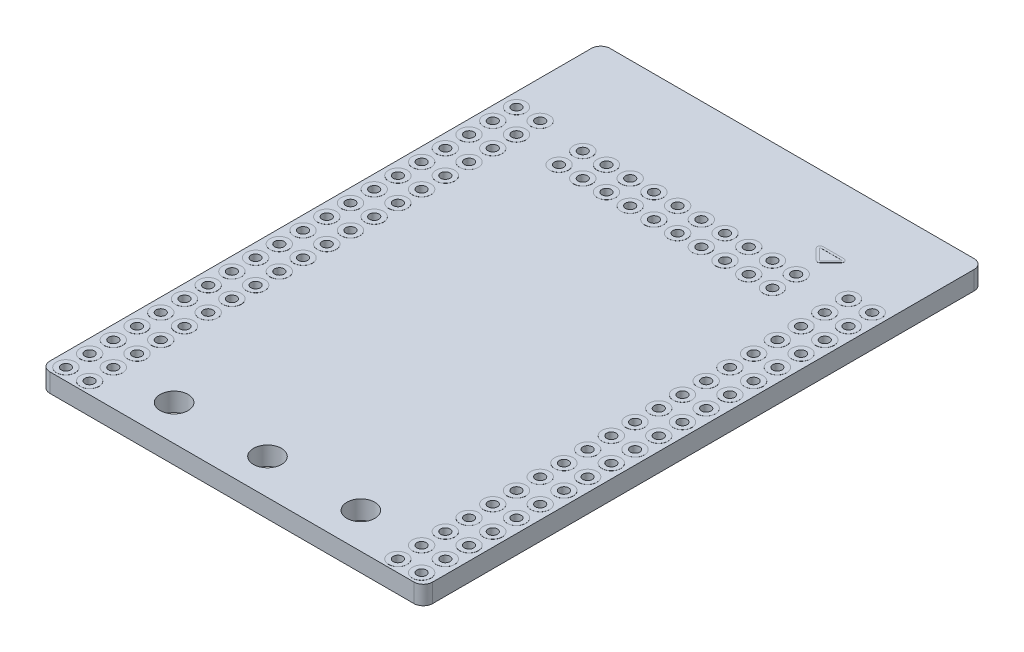
from build123d import *

# Parameters (mm, degrees)
BOSS_EXTRUDE1_DEPTH          = 2
SKETCH4_R                    = 1.5
CUT_EXTRUDE2_DEPTH           = 37.390245946
SKETCH2_R                    = 1
SKETCH2_R_2                  = 0.5
BOSS_EXTRUDE2_DEPTH          = 0.01
SKETCH3_R                    = 0.5
CUT_EXTRUDE1_DEPTH           = 37.390245946
LPATTERN3_COUNT              = 2
LPATTERN3_PITCH              = 2.54
LPATTERN4_COPY_1_SKETCH_R    = 1
LPATTERN4_COPY_1_SKETCH_R_2  = 0.5
LPATTERN4_COPY_1_DEPTH       = 0.01
LPATTERN4_COPY_2_SKETCH_R    = 1
LPATTERN4_COPY_2_SKETCH_R_2  = 0.5
LPATTERN4_COPY_2_DEPTH       = 0.01
LPATTERN4_COPY_3_SKETCH_R    = 1
LPATTERN4_COPY_3_SKETCH_R_2  = 0.5
LPATTERN4_COPY_3_DEPTH       = 0.01
LPATTERN4_COPY_4_SKETCH_R    = 1
LPATTERN4_COPY_4_SKETCH_R_2  = 0.5
LPATTERN4_COPY_4_DEPTH       = 0.01
LPATTERN4_COPY_5_SKETCH_R    = 0.5
LPATTERN4_COPY_5_DEPTH       = 37.390245946
LPATTERN4_COPY_6_SKETCH_R    = 0.5
LPATTERN4_COPY_6_DEPTH       = 37.390245946
LPATTERN4_COPY_7_SKETCH_R    = 0.5
LPATTERN4_COPY_7_DEPTH       = 37.390245946
LPATTERN4_COPY_8_SKETCH_R    = 0.5
LPATTERN4_COPY_8_DEPTH       = 37.390245946
LPATTERN4_COPY_9_SKETCH_R    = 1
LPATTERN4_COPY_9_SKETCH_R_2  = 0.5
LPATTERN4_COPY_9_DEPTH       = 0.01
LPATTERN4_COPY_10_SKETCH_R   = 1
LPATTERN4_COPY_10_SKETCH_R_2 = 0.5
LPATTERN4_COPY_10_DEPTH      = 0.01
LPATTERN4_COPY_11_SKETCH_R   = 1
LPATTERN4_COPY_11_SKETCH_R_2 = 0.5
LPATTERN4_COPY_11_DEPTH      = 0.01
LPATTERN4_COPY_12_SKETCH_R   = 1
LPATTERN4_COPY_12_SKETCH_R_2 = 0.5
LPATTERN4_COPY_12_DEPTH      = 0.01
LPATTERN4_COPY_13_SKETCH_R   = 0.5
LPATTERN4_COPY_13_DEPTH      = 37.390245946
LPATTERN4_COPY_14_SKETCH_R   = 0.5
LPATTERN4_COPY_14_DEPTH      = 37.390245946
LPATTERN4_COPY_15_SKETCH_R   = 0.5
LPATTERN4_COPY_15_DEPTH      = 37.390245946
LPATTERN4_COPY_16_SKETCH_R   = 0.5
LPATTERN4_COPY_16_DEPTH      = 37.390245946
LPATTERN5_COPY_1_SKETCH_R    = 1
LPATTERN5_COPY_1_SKETCH_R_2  = 0.5
LPATTERN5_COPY_1_DEPTH       = 0.01
LPATTERN5_COPY_2_SKETCH_R    = 1
LPATTERN5_COPY_2_SKETCH_R_2  = 0.5
LPATTERN5_COPY_2_DEPTH       = 0.01
LPATTERN5_COPY_3_SKETCH_R    = 1
LPATTERN5_COPY_3_SKETCH_R_2  = 0.5
LPATTERN5_COPY_3_DEPTH       = 0.01
LPATTERN5_COPY_4_SKETCH_R    = 1
LPATTERN5_COPY_4_SKETCH_R_2  = 0.5
LPATTERN5_COPY_4_DEPTH       = 0.01
LPATTERN5_COPY_5_SKETCH_R    = 1
LPATTERN5_COPY_5_SKETCH_R_2  = 0.5
LPATTERN5_COPY_5_DEPTH       = 0.01
LPATTERN5_COPY_6_SKETCH_R    = 0.5
LPATTERN5_COPY_6_DEPTH       = 37.390245946
LPATTERN5_COPY_7_SKETCH_R    = 0.5
LPATTERN5_COPY_7_DEPTH       = 37.390245946
LPATTERN5_COPY_8_SKETCH_R    = 0.5
LPATTERN5_COPY_8_DEPTH       = 37.390245946
LPATTERN5_COPY_9_SKETCH_R    = 0.5
LPATTERN5_COPY_9_DEPTH       = 37.390245946
LPATTERN5_COPY_10_SKETCH_R   = 0.5
LPATTERN5_COPY_10_DEPTH      = 37.390245946
LPATTERN5_COPY_11_SKETCH_R   = 1
LPATTERN5_COPY_11_SKETCH_R_2 = 0.5
LPATTERN5_COPY_11_DEPTH      = 0.01
LPATTERN5_COPY_12_SKETCH_R   = 1
LPATTERN5_COPY_12_SKETCH_R_2 = 0.5
LPATTERN5_COPY_12_DEPTH      = 0.01
LPATTERN5_COPY_13_SKETCH_R   = 1
LPATTERN5_COPY_13_SKETCH_R_2 = 0.5
LPATTERN5_COPY_13_DEPTH      = 0.01
LPATTERN5_COPY_14_SKETCH_R   = 1
LPATTERN5_COPY_14_SKETCH_R_2 = 0.5
LPATTERN5_COPY_14_DEPTH      = 0.01
LPATTERN5_COPY_15_SKETCH_R   = 1
LPATTERN5_COPY_15_SKETCH_R_2 = 0.5
LPATTERN5_COPY_15_DEPTH      = 0.01
LPATTERN5_COPY_16_SKETCH_R   = 0.5
LPATTERN5_COPY_16_DEPTH      = 37.390245946
LPATTERN5_COPY_17_SKETCH_R   = 0.5
LPATTERN5_COPY_17_DEPTH      = 37.390245946
LPATTERN5_COPY_18_SKETCH_R   = 0.5
LPATTERN5_COPY_18_DEPTH      = 37.390245946
LPATTERN5_COPY_19_SKETCH_R   = 0.5
LPATTERN5_COPY_19_DEPTH      = 37.390245946
LPATTERN5_COPY_20_SKETCH_R   = 0.5
LPATTERN5_COPY_20_DEPTH      = 37.390245946
SKETCH5_R                    = 1
SKETCH5_R_2                  = 0.5
BOSS_EXTRUDE3_DEPTH          = 0.01
SKETCH6_R                    = 0.5
CUT_EXTRUDE3_DEPTH           = 37.390245946
LPATTERN6_COUNT              = 2
LPATTERN6_PITCH              = 2.54
LPATTERN7_COPY_1_SKETCH_R    = 1
LPATTERN7_COPY_1_SKETCH_R_2  = 0.5
LPATTERN7_COPY_1_DEPTH       = 0.01
LPATTERN7_COPY_2_SKETCH_R    = 1
LPATTERN7_COPY_2_SKETCH_R_2  = 0.5
LPATTERN7_COPY_2_DEPTH       = 0.01
LPATTERN7_COPY_3_SKETCH_R    = 1
LPATTERN7_COPY_3_SKETCH_R_2  = 0.5
LPATTERN7_COPY_3_DEPTH       = 0.01
LPATTERN7_COPY_4_SKETCH_R    = 1
LPATTERN7_COPY_4_SKETCH_R_2  = 0.5
LPATTERN7_COPY_4_DEPTH       = 0.01
LPATTERN7_COPY_5_SKETCH_R    = 1
LPATTERN7_COPY_5_SKETCH_R_2  = 0.5
LPATTERN7_COPY_5_DEPTH       = 0.01
LPATTERN7_COPY_6_SKETCH_R    = 1
LPATTERN7_COPY_6_SKETCH_R_2  = 0.5
LPATTERN7_COPY_6_DEPTH       = 0.01
LPATTERN7_COPY_7_SKETCH_R    = 1
LPATTERN7_COPY_7_SKETCH_R_2  = 0.5
LPATTERN7_COPY_7_DEPTH       = 0.01
LPATTERN7_COPY_8_SKETCH_R    = 1
LPATTERN7_COPY_8_SKETCH_R_2  = 0.5
LPATTERN7_COPY_8_DEPTH       = 0.01
LPATTERN7_COPY_9_SKETCH_R    = 1
LPATTERN7_COPY_9_SKETCH_R_2  = 0.5
LPATTERN7_COPY_9_DEPTH       = 0.01
LPATTERN7_COPY_10_SKETCH_R   = 1
LPATTERN7_COPY_10_SKETCH_R_2 = 0.5
LPATTERN7_COPY_10_DEPTH      = 0.01
LPATTERN7_COPY_11_SKETCH_R   = 1
LPATTERN7_COPY_11_SKETCH_R_2 = 0.5
LPATTERN7_COPY_11_DEPTH      = 0.01
LPATTERN7_COPY_12_SKETCH_R   = 1
LPATTERN7_COPY_12_SKETCH_R_2 = 0.5
LPATTERN7_COPY_12_DEPTH      = 0.01
LPATTERN7_COPY_13_SKETCH_R   = 1
LPATTERN7_COPY_13_SKETCH_R_2 = 0.5
LPATTERN7_COPY_13_DEPTH      = 0.01
LPATTERN7_COPY_14_SKETCH_R   = 1
LPATTERN7_COPY_14_SKETCH_R_2 = 0.5
LPATTERN7_COPY_14_DEPTH      = 0.01
LPATTERN7_COPY_15_SKETCH_R   = 1
LPATTERN7_COPY_15_SKETCH_R_2 = 0.5
LPATTERN7_COPY_15_DEPTH      = 0.01
LPATTERN7_COPY_16_SKETCH_R   = 1
LPATTERN7_COPY_16_SKETCH_R_2 = 0.5
LPATTERN7_COPY_16_DEPTH      = 0.01
LPATTERN7_COPY_17_SKETCH_R   = 1
LPATTERN7_COPY_17_SKETCH_R_2 = 0.5
LPATTERN7_COPY_17_DEPTH      = 0.01
LPATTERN7_COPY_18_SKETCH_R   = 1
LPATTERN7_COPY_18_SKETCH_R_2 = 0.5
LPATTERN7_COPY_18_DEPTH      = 0.01
LPATTERN7_COPY_19_SKETCH_R   = 1
LPATTERN7_COPY_19_SKETCH_R_2 = 0.5
LPATTERN7_COPY_19_DEPTH      = 0.01
LPATTERN7_COPY_20_SKETCH_R   = 0.5
LPATTERN7_COPY_20_DEPTH      = 37.390245946
LPATTERN7_COPY_21_SKETCH_R   = 0.5
LPATTERN7_COPY_21_DEPTH      = 37.390245946
LPATTERN7_COPY_22_SKETCH_R   = 0.5
LPATTERN7_COPY_22_DEPTH      = 37.390245946
LPATTERN7_COPY_23_SKETCH_R   = 0.5
LPATTERN7_COPY_23_DEPTH      = 37.390245946
LPATTERN7_COPY_24_SKETCH_R   = 0.5
LPATTERN7_COPY_24_DEPTH      = 37.390245946
LPATTERN7_COPY_25_SKETCH_R   = 0.5
LPATTERN7_COPY_25_DEPTH      = 37.390245946
LPATTERN7_COPY_26_SKETCH_R   = 0.5
LPATTERN7_COPY_26_DEPTH      = 37.390245946
LPATTERN7_COPY_27_SKETCH_R   = 0.5
LPATTERN7_COPY_27_DEPTH      = 37.390245946
LPATTERN7_COPY_28_SKETCH_R   = 0.5
LPATTERN7_COPY_28_DEPTH      = 37.390245946
LPATTERN7_COPY_29_SKETCH_R   = 0.5
LPATTERN7_COPY_29_DEPTH      = 37.390245946
LPATTERN7_COPY_30_SKETCH_R   = 0.5
LPATTERN7_COPY_30_DEPTH      = 37.390245946
LPATTERN7_COPY_31_SKETCH_R   = 0.5
LPATTERN7_COPY_31_DEPTH      = 37.390245946
LPATTERN7_COPY_32_SKETCH_R   = 0.5
LPATTERN7_COPY_32_DEPTH      = 37.390245946
LPATTERN7_COPY_33_SKETCH_R   = 0.5
LPATTERN7_COPY_33_DEPTH      = 37.390245946
LPATTERN7_COPY_34_SKETCH_R   = 0.5
LPATTERN7_COPY_34_DEPTH      = 37.390245946
LPATTERN7_COPY_35_SKETCH_R   = 0.5
LPATTERN7_COPY_35_DEPTH      = 37.390245946
LPATTERN7_COPY_36_SKETCH_R   = 0.5
LPATTERN7_COPY_36_DEPTH      = 37.390245946
LPATTERN7_COPY_37_SKETCH_R   = 0.5
LPATTERN7_COPY_37_DEPTH      = 37.390245946
LPATTERN7_COPY_38_SKETCH_R   = 0.5
LPATTERN7_COPY_38_DEPTH      = 37.390245946
LPATTERN7_COPY_39_SKETCH_R   = 1
LPATTERN7_COPY_39_SKETCH_R_2 = 0.5
LPATTERN7_COPY_39_DEPTH      = 0.01
LPATTERN7_COPY_40_SKETCH_R   = 1
LPATTERN7_COPY_40_SKETCH_R_2 = 0.5
LPATTERN7_COPY_40_DEPTH      = 0.01
LPATTERN7_COPY_41_SKETCH_R   = 1
LPATTERN7_COPY_41_SKETCH_R_2 = 0.5
LPATTERN7_COPY_41_DEPTH      = 0.01
LPATTERN7_COPY_42_SKETCH_R   = 1
LPATTERN7_COPY_42_SKETCH_R_2 = 0.5
LPATTERN7_COPY_42_DEPTH      = 0.01
LPATTERN7_COPY_43_SKETCH_R   = 1
LPATTERN7_COPY_43_SKETCH_R_2 = 0.5
LPATTERN7_COPY_43_DEPTH      = 0.01
LPATTERN7_COPY_44_SKETCH_R   = 1
LPATTERN7_COPY_44_SKETCH_R_2 = 0.5
LPATTERN7_COPY_44_DEPTH      = 0.01
LPATTERN7_COPY_45_SKETCH_R   = 1
LPATTERN7_COPY_45_SKETCH_R_2 = 0.5
LPATTERN7_COPY_45_DEPTH      = 0.01
LPATTERN7_COPY_46_SKETCH_R   = 1
LPATTERN7_COPY_46_SKETCH_R_2 = 0.5
LPATTERN7_COPY_46_DEPTH      = 0.01
LPATTERN7_COPY_47_SKETCH_R   = 1
LPATTERN7_COPY_47_SKETCH_R_2 = 0.5
LPATTERN7_COPY_47_DEPTH      = 0.01
LPATTERN7_COPY_48_SKETCH_R   = 1
LPATTERN7_COPY_48_SKETCH_R_2 = 0.5
LPATTERN7_COPY_48_DEPTH      = 0.01
LPATTERN7_COPY_49_SKETCH_R   = 1
LPATTERN7_COPY_49_SKETCH_R_2 = 0.5
LPATTERN7_COPY_49_DEPTH      = 0.01
LPATTERN7_COPY_50_SKETCH_R   = 1
LPATTERN7_COPY_50_SKETCH_R_2 = 0.5
LPATTERN7_COPY_50_DEPTH      = 0.01
LPATTERN7_COPY_51_SKETCH_R   = 1
LPATTERN7_COPY_51_SKETCH_R_2 = 0.5
LPATTERN7_COPY_51_DEPTH      = 0.01
LPATTERN7_COPY_52_SKETCH_R   = 1
LPATTERN7_COPY_52_SKETCH_R_2 = 0.5
LPATTERN7_COPY_52_DEPTH      = 0.01
LPATTERN7_COPY_53_SKETCH_R   = 1
LPATTERN7_COPY_53_SKETCH_R_2 = 0.5
LPATTERN7_COPY_53_DEPTH      = 0.01
LPATTERN7_COPY_54_SKETCH_R   = 1
LPATTERN7_COPY_54_SKETCH_R_2 = 0.5
LPATTERN7_COPY_54_DEPTH      = 0.01
LPATTERN7_COPY_55_SKETCH_R   = 1
LPATTERN7_COPY_55_SKETCH_R_2 = 0.5
LPATTERN7_COPY_55_DEPTH      = 0.01
LPATTERN7_COPY_56_SKETCH_R   = 1
LPATTERN7_COPY_56_SKETCH_R_2 = 0.5
LPATTERN7_COPY_56_DEPTH      = 0.01
LPATTERN7_COPY_57_SKETCH_R   = 1
LPATTERN7_COPY_57_SKETCH_R_2 = 0.5
LPATTERN7_COPY_57_DEPTH      = 0.01
LPATTERN7_COPY_58_SKETCH_R   = 0.5
LPATTERN7_COPY_58_DEPTH      = 37.390245946
LPATTERN7_COPY_59_SKETCH_R   = 0.5
LPATTERN7_COPY_59_DEPTH      = 37.390245946
LPATTERN7_COPY_60_SKETCH_R   = 0.5
LPATTERN7_COPY_60_DEPTH      = 37.390245946
LPATTERN7_COPY_61_SKETCH_R   = 0.5
LPATTERN7_COPY_61_DEPTH      = 37.390245946
LPATTERN7_COPY_62_SKETCH_R   = 0.5
LPATTERN7_COPY_62_DEPTH      = 37.390245946
LPATTERN7_COPY_63_SKETCH_R   = 0.5
LPATTERN7_COPY_63_DEPTH      = 37.390245946
LPATTERN7_COPY_64_SKETCH_R   = 0.5
LPATTERN7_COPY_64_DEPTH      = 37.390245946
LPATTERN7_COPY_65_SKETCH_R   = 0.5
LPATTERN7_COPY_65_DEPTH      = 37.390245946
LPATTERN7_COPY_66_SKETCH_R   = 0.5
LPATTERN7_COPY_66_DEPTH      = 37.390245946
LPATTERN7_COPY_67_SKETCH_R   = 0.5
LPATTERN7_COPY_67_DEPTH      = 37.390245946
LPATTERN7_COPY_68_SKETCH_R   = 0.5
LPATTERN7_COPY_68_DEPTH      = 37.390245946
LPATTERN7_COPY_69_SKETCH_R   = 0.5
LPATTERN7_COPY_69_DEPTH      = 37.390245946
LPATTERN7_COPY_70_SKETCH_R   = 0.5
LPATTERN7_COPY_70_DEPTH      = 37.390245946
LPATTERN7_COPY_71_SKETCH_R   = 0.5
LPATTERN7_COPY_71_DEPTH      = 37.390245946
LPATTERN7_COPY_72_SKETCH_R   = 0.5
LPATTERN7_COPY_72_DEPTH      = 37.390245946
LPATTERN7_COPY_73_SKETCH_R   = 0.5
LPATTERN7_COPY_73_DEPTH      = 37.390245946
LPATTERN7_COPY_74_SKETCH_R   = 0.5
LPATTERN7_COPY_74_DEPTH      = 37.390245946
LPATTERN7_COPY_75_SKETCH_R   = 0.5
LPATTERN7_COPY_75_DEPTH      = 37.390245946
LPATTERN7_COPY_76_SKETCH_R   = 0.5
LPATTERN7_COPY_76_DEPTH      = 37.390245946
SKETCH7_R                    = 1
SKETCH7_R_2                  = 0.5
BOSS_EXTRUDE4_DEPTH          = 0.01
SKETCH8_R                    = 0.5
CUT_EXTRUDE4_DEPTH           = 37.390245946
LPATTERN8_COUNT              = 2
LPATTERN8_PITCH              = 2.54
LPATTERN9_COPY_1_SKETCH_R    = 1
LPATTERN9_COPY_1_SKETCH_R_2  = 0.5
LPATTERN9_COPY_1_DEPTH       = 0.01
LPATTERN9_COPY_2_SKETCH_R    = 1
LPATTERN9_COPY_2_SKETCH_R_2  = 0.5
LPATTERN9_COPY_2_DEPTH       = 0.01
LPATTERN9_COPY_3_SKETCH_R    = 1
LPATTERN9_COPY_3_SKETCH_R_2  = 0.5
LPATTERN9_COPY_3_DEPTH       = 0.01
LPATTERN9_COPY_4_SKETCH_R    = 1
LPATTERN9_COPY_4_SKETCH_R_2  = 0.5
LPATTERN9_COPY_4_DEPTH       = 0.01
LPATTERN9_COPY_5_SKETCH_R    = 1
LPATTERN9_COPY_5_SKETCH_R_2  = 0.5
LPATTERN9_COPY_5_DEPTH       = 0.01
LPATTERN9_COPY_6_SKETCH_R    = 1
LPATTERN9_COPY_6_SKETCH_R_2  = 0.5
LPATTERN9_COPY_6_DEPTH       = 0.01
LPATTERN9_COPY_7_SKETCH_R    = 1
LPATTERN9_COPY_7_SKETCH_R_2  = 0.5
LPATTERN9_COPY_7_DEPTH       = 0.01
LPATTERN9_COPY_8_SKETCH_R    = 1
LPATTERN9_COPY_8_SKETCH_R_2  = 0.5
LPATTERN9_COPY_8_DEPTH       = 0.01
LPATTERN9_COPY_9_SKETCH_R    = 1
LPATTERN9_COPY_9_SKETCH_R_2  = 0.5
LPATTERN9_COPY_9_DEPTH       = 0.01
LPATTERN9_COPY_10_SKETCH_R   = 1
LPATTERN9_COPY_10_SKETCH_R_2 = 0.5
LPATTERN9_COPY_10_DEPTH      = 0.01
LPATTERN9_COPY_11_SKETCH_R   = 1
LPATTERN9_COPY_11_SKETCH_R_2 = 0.5
LPATTERN9_COPY_11_DEPTH      = 0.01
LPATTERN9_COPY_12_SKETCH_R   = 1
LPATTERN9_COPY_12_SKETCH_R_2 = 0.5
LPATTERN9_COPY_12_DEPTH      = 0.01
LPATTERN9_COPY_13_SKETCH_R   = 1
LPATTERN9_COPY_13_SKETCH_R_2 = 0.5
LPATTERN9_COPY_13_DEPTH      = 0.01
LPATTERN9_COPY_14_SKETCH_R   = 1
LPATTERN9_COPY_14_SKETCH_R_2 = 0.5
LPATTERN9_COPY_14_DEPTH      = 0.01
LPATTERN9_COPY_15_SKETCH_R   = 1
LPATTERN9_COPY_15_SKETCH_R_2 = 0.5
LPATTERN9_COPY_15_DEPTH      = 0.01
LPATTERN9_COPY_16_SKETCH_R   = 1
LPATTERN9_COPY_16_SKETCH_R_2 = 0.5
LPATTERN9_COPY_16_DEPTH      = 0.01
LPATTERN9_COPY_17_SKETCH_R   = 1
LPATTERN9_COPY_17_SKETCH_R_2 = 0.5
LPATTERN9_COPY_17_DEPTH      = 0.01
LPATTERN9_COPY_18_SKETCH_R   = 1
LPATTERN9_COPY_18_SKETCH_R_2 = 0.5
LPATTERN9_COPY_18_DEPTH      = 0.01
LPATTERN9_COPY_19_SKETCH_R   = 1
LPATTERN9_COPY_19_SKETCH_R_2 = 0.5
LPATTERN9_COPY_19_DEPTH      = 0.01
LPATTERN9_COPY_20_SKETCH_R   = 0.5
LPATTERN9_COPY_20_DEPTH      = 37.390245946
LPATTERN9_COPY_21_SKETCH_R   = 0.5
LPATTERN9_COPY_21_DEPTH      = 37.390245946
LPATTERN9_COPY_22_SKETCH_R   = 0.5
LPATTERN9_COPY_22_DEPTH      = 37.390245946
LPATTERN9_COPY_23_SKETCH_R   = 0.5
LPATTERN9_COPY_23_DEPTH      = 37.390245946
LPATTERN9_COPY_24_SKETCH_R   = 0.5
LPATTERN9_COPY_24_DEPTH      = 37.390245946
LPATTERN9_COPY_25_SKETCH_R   = 0.5
LPATTERN9_COPY_25_DEPTH      = 37.390245946
LPATTERN9_COPY_26_SKETCH_R   = 0.5
LPATTERN9_COPY_26_DEPTH      = 37.390245946
LPATTERN9_COPY_27_SKETCH_R   = 0.5
LPATTERN9_COPY_27_DEPTH      = 37.390245946
LPATTERN9_COPY_28_SKETCH_R   = 0.5
LPATTERN9_COPY_28_DEPTH      = 37.390245946
LPATTERN9_COPY_29_SKETCH_R   = 0.5
LPATTERN9_COPY_29_DEPTH      = 37.390245946
LPATTERN9_COPY_30_SKETCH_R   = 0.5
LPATTERN9_COPY_30_DEPTH      = 37.390245946
LPATTERN9_COPY_31_SKETCH_R   = 0.5
LPATTERN9_COPY_31_DEPTH      = 37.390245946
LPATTERN9_COPY_32_SKETCH_R   = 0.5
LPATTERN9_COPY_32_DEPTH      = 37.390245946
LPATTERN9_COPY_33_SKETCH_R   = 0.5
LPATTERN9_COPY_33_DEPTH      = 37.390245946
LPATTERN9_COPY_34_SKETCH_R   = 0.5
LPATTERN9_COPY_34_DEPTH      = 37.390245946
LPATTERN9_COPY_35_SKETCH_R   = 0.5
LPATTERN9_COPY_35_DEPTH      = 37.390245946
LPATTERN9_COPY_36_SKETCH_R   = 0.5
LPATTERN9_COPY_36_DEPTH      = 37.390245946
LPATTERN9_COPY_37_SKETCH_R   = 0.5
LPATTERN9_COPY_37_DEPTH      = 37.390245946
LPATTERN9_COPY_38_SKETCH_R   = 0.5
LPATTERN9_COPY_38_DEPTH      = 37.390245946
LPATTERN9_COPY_39_SKETCH_R   = 1
LPATTERN9_COPY_39_SKETCH_R_2 = 0.5
LPATTERN9_COPY_39_DEPTH      = 0.01
LPATTERN9_COPY_40_SKETCH_R   = 1
LPATTERN9_COPY_40_SKETCH_R_2 = 0.5
LPATTERN9_COPY_40_DEPTH      = 0.01
LPATTERN9_COPY_41_SKETCH_R   = 1
LPATTERN9_COPY_41_SKETCH_R_2 = 0.5
LPATTERN9_COPY_41_DEPTH      = 0.01
LPATTERN9_COPY_42_SKETCH_R   = 1
LPATTERN9_COPY_42_SKETCH_R_2 = 0.5
LPATTERN9_COPY_42_DEPTH      = 0.01
LPATTERN9_COPY_43_SKETCH_R   = 1
LPATTERN9_COPY_43_SKETCH_R_2 = 0.5
LPATTERN9_COPY_43_DEPTH      = 0.01
LPATTERN9_COPY_44_SKETCH_R   = 1
LPATTERN9_COPY_44_SKETCH_R_2 = 0.5
LPATTERN9_COPY_44_DEPTH      = 0.01
LPATTERN9_COPY_45_SKETCH_R   = 1
LPATTERN9_COPY_45_SKETCH_R_2 = 0.5
LPATTERN9_COPY_45_DEPTH      = 0.01
LPATTERN9_COPY_46_SKETCH_R   = 1
LPATTERN9_COPY_46_SKETCH_R_2 = 0.5
LPATTERN9_COPY_46_DEPTH      = 0.01
LPATTERN9_COPY_47_SKETCH_R   = 1
LPATTERN9_COPY_47_SKETCH_R_2 = 0.5
LPATTERN9_COPY_47_DEPTH      = 0.01
LPATTERN9_COPY_48_SKETCH_R   = 1
LPATTERN9_COPY_48_SKETCH_R_2 = 0.5
LPATTERN9_COPY_48_DEPTH      = 0.01
LPATTERN9_COPY_49_SKETCH_R   = 1
LPATTERN9_COPY_49_SKETCH_R_2 = 0.5
LPATTERN9_COPY_49_DEPTH      = 0.01
LPATTERN9_COPY_50_SKETCH_R   = 1
LPATTERN9_COPY_50_SKETCH_R_2 = 0.5
LPATTERN9_COPY_50_DEPTH      = 0.01
LPATTERN9_COPY_51_SKETCH_R   = 1
LPATTERN9_COPY_51_SKETCH_R_2 = 0.5
LPATTERN9_COPY_51_DEPTH      = 0.01
LPATTERN9_COPY_52_SKETCH_R   = 1
LPATTERN9_COPY_52_SKETCH_R_2 = 0.5
LPATTERN9_COPY_52_DEPTH      = 0.01
LPATTERN9_COPY_53_SKETCH_R   = 1
LPATTERN9_COPY_53_SKETCH_R_2 = 0.5
LPATTERN9_COPY_53_DEPTH      = 0.01
LPATTERN9_COPY_54_SKETCH_R   = 1
LPATTERN9_COPY_54_SKETCH_R_2 = 0.5
LPATTERN9_COPY_54_DEPTH      = 0.01
LPATTERN9_COPY_55_SKETCH_R   = 1
LPATTERN9_COPY_55_SKETCH_R_2 = 0.5
LPATTERN9_COPY_55_DEPTH      = 0.01
LPATTERN9_COPY_56_SKETCH_R   = 1
LPATTERN9_COPY_56_SKETCH_R_2 = 0.5
LPATTERN9_COPY_56_DEPTH      = 0.01
LPATTERN9_COPY_57_SKETCH_R   = 1
LPATTERN9_COPY_57_SKETCH_R_2 = 0.5
LPATTERN9_COPY_57_DEPTH      = 0.01
LPATTERN9_COPY_58_SKETCH_R   = 0.5
LPATTERN9_COPY_58_DEPTH      = 37.390245946
LPATTERN9_COPY_59_SKETCH_R   = 0.5
LPATTERN9_COPY_59_DEPTH      = 37.390245946
LPATTERN9_COPY_60_SKETCH_R   = 0.5
LPATTERN9_COPY_60_DEPTH      = 37.390245946
LPATTERN9_COPY_61_SKETCH_R   = 0.5
LPATTERN9_COPY_61_DEPTH      = 37.390245946
LPATTERN9_COPY_62_SKETCH_R   = 0.5
LPATTERN9_COPY_62_DEPTH      = 37.390245946
LPATTERN9_COPY_63_SKETCH_R   = 0.5
LPATTERN9_COPY_63_DEPTH      = 37.390245946
LPATTERN9_COPY_64_SKETCH_R   = 0.5
LPATTERN9_COPY_64_DEPTH      = 37.390245946
LPATTERN9_COPY_65_SKETCH_R   = 0.5
LPATTERN9_COPY_65_DEPTH      = 37.390245946
LPATTERN9_COPY_66_SKETCH_R   = 0.5
LPATTERN9_COPY_66_DEPTH      = 37.390245946
LPATTERN9_COPY_67_SKETCH_R   = 0.5
LPATTERN9_COPY_67_DEPTH      = 37.390245946
LPATTERN9_COPY_68_SKETCH_R   = 0.5
LPATTERN9_COPY_68_DEPTH      = 37.390245946
LPATTERN9_COPY_69_SKETCH_R   = 0.5
LPATTERN9_COPY_69_DEPTH      = 37.390245946
LPATTERN9_COPY_70_SKETCH_R   = 0.5
LPATTERN9_COPY_70_DEPTH      = 37.390245946
LPATTERN9_COPY_71_SKETCH_R   = 0.5
LPATTERN9_COPY_71_DEPTH      = 37.390245946
LPATTERN9_COPY_72_SKETCH_R   = 0.5
LPATTERN9_COPY_72_DEPTH      = 37.390245946
LPATTERN9_COPY_73_SKETCH_R   = 0.5
LPATTERN9_COPY_73_DEPTH      = 37.390245946
LPATTERN9_COPY_74_SKETCH_R   = 0.5
LPATTERN9_COPY_74_DEPTH      = 37.390245946
LPATTERN9_COPY_75_SKETCH_R   = 0.5
LPATTERN9_COPY_75_DEPTH      = 37.390245946
LPATTERN9_COPY_76_SKETCH_R   = 0.5
LPATTERN9_COPY_76_DEPTH      = 37.390245946
BOSS_EXTRUDE5_DEPTH          = 0.01


with BuildPart() as part:
    # Sketch1 → Boss-Extrude1 (new body)
    with BuildSketch(Plane(origin=(0, 0, 0), x_dir=(1, 0, 0), z_dir=(0, 1, 0))):
        with BuildLine():
            Line((-19.5, -30), (19.5, -30))
            ThreePointArc((19.5, -30), (20.207106781, -29.707106781), (20.5, -29))
            Line((20.5, -29), (20.5, 29))
            ThreePointArc((20.5, 29), (20.207106781, 29.707106781), (19.5, 30))
            Line((19.5, 30), (-19.5, 30))
            ThreePointArc((-19.5, 30), (-20.207106781, 29.707106781), (-20.5, 29))
            Line((-20.5, 29), (-20.5, -29))
            ThreePointArc((-20.5, -29), (-20.207106781, -29.707106781), (-19.5, -30))
        make_face()
    extrude(amount=BOSS_EXTRUDE1_DEPTH)

    # Sketch4 → Cut-Extrude2 (cut, through all)
    with BuildSketch(Plane(origin=(0, 2, 0), x_dir=(1, 0, 0), z_dir=(0, 1, 0))):
        with Locations((0, -26.19)):
            Circle(SKETCH4_R)
        with Locations((-10, -26.19)):
            Circle(SKETCH4_R)
        with Locations((10, -26.19)):
            Circle(SKETCH4_R)
    extrude(amount=-CUT_EXTRUDE2_DEPTH, mode=Mode.SUBTRACT)

    # Sketch2 → Boss-Extrude2 (add)
    with BuildSketch(Plane(origin=(0, 2, 0), x_dir=(1, 0, 0), z_dir=(0, 1, 0))):
        with Locations((-1.27, 19.01)):
            Circle(SKETCH2_R)
        with Locations((-1.27, 19.01)):
            Circle(SKETCH2_R_2, mode=Mode.SUBTRACT)
    boss_extrude2 = extrude(amount=BOSS_EXTRUDE2_DEPTH)

    # Sketch3 → Cut-Extrude1 (cut, symmetric)
    with BuildSketch(Plane(origin=(0, 2, 0), x_dir=(1, 0, 0), z_dir=(0, 1, 0))):
        with Locations((-1.27, 19.01)):
            Circle(SKETCH3_R)
    cut_extrude1 = extrude(amount=CUT_EXTRUDE1_DEPTH, both=True, mode=Mode.SUBTRACT)

    # LPattern3: Boss-Extrude2, Cut-Extrude1 ×2
    with Locations(*[(0, 0, i * LPATTERN3_PITCH) for i in range(1, LPATTERN3_COUNT)]):
        add(boss_extrude2)
        add(cut_extrude1, mode=Mode.SUBTRACT)

    # LPattern4 copy 1 sketch → LPattern4 copy 1 (add)
    with BuildSketch(Plane(origin=(-2.54, 2, 2.54), x_dir=(1, 0, 0), z_dir=(0, 1, 0))):
        with Locations((-1.27, 19.01)):
            Circle(LPATTERN4_COPY_1_SKETCH_R)
        with Locations((-1.27, 19.01)):
            Circle(LPATTERN4_COPY_1_SKETCH_R_2, mode=Mode.SUBTRACT)
    extrude(amount=LPATTERN4_COPY_1_DEPTH)

    # LPattern4 copy 2 sketch → LPattern4 copy 2 (add)
    with BuildSketch(Plane(origin=(-5.08, 2, 2.54), x_dir=(1, 0, 0), z_dir=(0, 1, 0))):
        with Locations((-1.27, 19.01)):
            Circle(LPATTERN4_COPY_2_SKETCH_R)
        with Locations((-1.27, 19.01)):
            Circle(LPATTERN4_COPY_2_SKETCH_R_2, mode=Mode.SUBTRACT)
    extrude(amount=LPATTERN4_COPY_2_DEPTH)

    # LPattern4 copy 3 sketch → LPattern4 copy 3 (add)
    with BuildSketch(Plane(origin=(-7.62, 2, 2.54), x_dir=(1, 0, 0), z_dir=(0, 1, 0))):
        with Locations((-1.27, 19.01)):
            Circle(LPATTERN4_COPY_3_SKETCH_R)
        with Locations((-1.27, 19.01)):
            Circle(LPATTERN4_COPY_3_SKETCH_R_2, mode=Mode.SUBTRACT)
    extrude(amount=LPATTERN4_COPY_3_DEPTH)

    # LPattern4 copy 4 sketch → LPattern4 copy 4 (add)
    with BuildSketch(Plane(origin=(-10.16, 2, 2.54), x_dir=(1, 0, 0), z_dir=(0, 1, 0))):
        with Locations((-1.27, 19.01)):
            Circle(LPATTERN4_COPY_4_SKETCH_R)
        with Locations((-1.27, 19.01)):
            Circle(LPATTERN4_COPY_4_SKETCH_R_2, mode=Mode.SUBTRACT)
    extrude(amount=LPATTERN4_COPY_4_DEPTH)

    # LPattern4 copy 5 sketch → LPattern4 copy 5 (cut, symmetric)
    with BuildSketch(Plane(origin=(-2.54, 2, 2.54), x_dir=(1, 0, 0), z_dir=(0, 1, 0))):
        with Locations((-1.27, 19.01)):
            Circle(LPATTERN4_COPY_5_SKETCH_R)
    extrude(amount=LPATTERN4_COPY_5_DEPTH, both=True, mode=Mode.SUBTRACT)

    # LPattern4 copy 6 sketch → LPattern4 copy 6 (cut, symmetric)
    with BuildSketch(Plane(origin=(-5.08, 2, 2.54), x_dir=(1, 0, 0), z_dir=(0, 1, 0))):
        with Locations((-1.27, 19.01)):
            Circle(LPATTERN4_COPY_6_SKETCH_R)
    extrude(amount=LPATTERN4_COPY_6_DEPTH, both=True, mode=Mode.SUBTRACT)

    # LPattern4 copy 7 sketch → LPattern4 copy 7 (cut, symmetric)
    with BuildSketch(Plane(origin=(-7.62, 2, 2.54), x_dir=(1, 0, 0), z_dir=(0, 1, 0))):
        with Locations((-1.27, 19.01)):
            Circle(LPATTERN4_COPY_7_SKETCH_R)
    extrude(amount=LPATTERN4_COPY_7_DEPTH, both=True, mode=Mode.SUBTRACT)

    # LPattern4 copy 8 sketch → LPattern4 copy 8 (cut, symmetric)
    with BuildSketch(Plane(origin=(-10.16, 2, 2.54), x_dir=(1, 0, 0), z_dir=(0, 1, 0))):
        with Locations((-1.27, 19.01)):
            Circle(LPATTERN4_COPY_8_SKETCH_R)
    extrude(amount=LPATTERN4_COPY_8_DEPTH, both=True, mode=Mode.SUBTRACT)

    # LPattern4 copy 9 sketch → LPattern4 copy 9 (add)
    with BuildSketch(Plane(origin=(-2.54, 2, 0), x_dir=(1, 0, 0), z_dir=(0, 1, 0))):
        with Locations((-1.27, 19.01)):
            Circle(LPATTERN4_COPY_9_SKETCH_R)
        with Locations((-1.27, 19.01)):
            Circle(LPATTERN4_COPY_9_SKETCH_R_2, mode=Mode.SUBTRACT)
    extrude(amount=LPATTERN4_COPY_9_DEPTH)

    # LPattern4 copy 10 sketch → LPattern4 copy 10 (add)
    with BuildSketch(Plane(origin=(-5.08, 2, 0), x_dir=(1, 0, 0), z_dir=(0, 1, 0))):
        with Locations((-1.27, 19.01)):
            Circle(LPATTERN4_COPY_10_SKETCH_R)
        with Locations((-1.27, 19.01)):
            Circle(LPATTERN4_COPY_10_SKETCH_R_2, mode=Mode.SUBTRACT)
    extrude(amount=LPATTERN4_COPY_10_DEPTH)

    # LPattern4 copy 11 sketch → LPattern4 copy 11 (add)
    with BuildSketch(Plane(origin=(-7.62, 2, 0), x_dir=(1, 0, 0), z_dir=(0, 1, 0))):
        with Locations((-1.27, 19.01)):
            Circle(LPATTERN4_COPY_11_SKETCH_R)
        with Locations((-1.27, 19.01)):
            Circle(LPATTERN4_COPY_11_SKETCH_R_2, mode=Mode.SUBTRACT)
    extrude(amount=LPATTERN4_COPY_11_DEPTH)

    # LPattern4 copy 12 sketch → LPattern4 copy 12 (add)
    with BuildSketch(Plane(origin=(-10.16, 2, 0), x_dir=(1, 0, 0), z_dir=(0, 1, 0))):
        with Locations((-1.27, 19.01)):
            Circle(LPATTERN4_COPY_12_SKETCH_R)
        with Locations((-1.27, 19.01)):
            Circle(LPATTERN4_COPY_12_SKETCH_R_2, mode=Mode.SUBTRACT)
    extrude(amount=LPATTERN4_COPY_12_DEPTH)

    # LPattern4 copy 13 sketch → LPattern4 copy 13 (cut, symmetric)
    with BuildSketch(Plane(origin=(-2.54, 2, 0), x_dir=(1, 0, 0), z_dir=(0, 1, 0))):
        with Locations((-1.27, 19.01)):
            Circle(LPATTERN4_COPY_13_SKETCH_R)
    extrude(amount=LPATTERN4_COPY_13_DEPTH, both=True, mode=Mode.SUBTRACT)

    # LPattern4 copy 14 sketch → LPattern4 copy 14 (cut, symmetric)
    with BuildSketch(Plane(origin=(-5.08, 2, 0), x_dir=(1, 0, 0), z_dir=(0, 1, 0))):
        with Locations((-1.27, 19.01)):
            Circle(LPATTERN4_COPY_14_SKETCH_R)
    extrude(amount=LPATTERN4_COPY_14_DEPTH, both=True, mode=Mode.SUBTRACT)

    # LPattern4 copy 15 sketch → LPattern4 copy 15 (cut, symmetric)
    with BuildSketch(Plane(origin=(-7.62, 2, 0), x_dir=(1, 0, 0), z_dir=(0, 1, 0))):
        with Locations((-1.27, 19.01)):
            Circle(LPATTERN4_COPY_15_SKETCH_R)
    extrude(amount=LPATTERN4_COPY_15_DEPTH, both=True, mode=Mode.SUBTRACT)

    # LPattern4 copy 16 sketch → LPattern4 copy 16 (cut, symmetric)
    with BuildSketch(Plane(origin=(-10.16, 2, 0), x_dir=(1, 0, 0), z_dir=(0, 1, 0))):
        with Locations((-1.27, 19.01)):
            Circle(LPATTERN4_COPY_16_SKETCH_R)
    extrude(amount=LPATTERN4_COPY_16_DEPTH, both=True, mode=Mode.SUBTRACT)

    # LPattern5 copy 1 sketch → LPattern5 copy 1 (add)
    with BuildSketch(Plane(origin=(2.54, 2, 2.54), x_dir=(1, 0, 0), z_dir=(0, 1, 0))):
        with Locations((-1.27, 19.01)):
            Circle(LPATTERN5_COPY_1_SKETCH_R)
        with Locations((-1.27, 19.01)):
            Circle(LPATTERN5_COPY_1_SKETCH_R_2, mode=Mode.SUBTRACT)
    extrude(amount=LPATTERN5_COPY_1_DEPTH)

    # LPattern5 copy 2 sketch → LPattern5 copy 2 (add)
    with BuildSketch(Plane(origin=(5.08, 2, 2.54), x_dir=(1, 0, 0), z_dir=(0, 1, 0))):
        with Locations((-1.27, 19.01)):
            Circle(LPATTERN5_COPY_2_SKETCH_R)
        with Locations((-1.27, 19.01)):
            Circle(LPATTERN5_COPY_2_SKETCH_R_2, mode=Mode.SUBTRACT)
    extrude(amount=LPATTERN5_COPY_2_DEPTH)

    # LPattern5 copy 3 sketch → LPattern5 copy 3 (add)
    with BuildSketch(Plane(origin=(7.62, 2, 2.54), x_dir=(1, 0, 0), z_dir=(0, 1, 0))):
        with Locations((-1.27, 19.01)):
            Circle(LPATTERN5_COPY_3_SKETCH_R)
        with Locations((-1.27, 19.01)):
            Circle(LPATTERN5_COPY_3_SKETCH_R_2, mode=Mode.SUBTRACT)
    extrude(amount=LPATTERN5_COPY_3_DEPTH)

    # LPattern5 copy 4 sketch → LPattern5 copy 4 (add)
    with BuildSketch(Plane(origin=(10.16, 2, 2.54), x_dir=(1, 0, 0), z_dir=(0, 1, 0))):
        with Locations((-1.27, 19.01)):
            Circle(LPATTERN5_COPY_4_SKETCH_R)
        with Locations((-1.27, 19.01)):
            Circle(LPATTERN5_COPY_4_SKETCH_R_2, mode=Mode.SUBTRACT)
    extrude(amount=LPATTERN5_COPY_4_DEPTH)

    # LPattern5 copy 5 sketch → LPattern5 copy 5 (add)
    with BuildSketch(Plane(origin=(12.7, 2, 2.54), x_dir=(1, 0, 0), z_dir=(0, 1, 0))):
        with Locations((-1.27, 19.01)):
            Circle(LPATTERN5_COPY_5_SKETCH_R)
        with Locations((-1.27, 19.01)):
            Circle(LPATTERN5_COPY_5_SKETCH_R_2, mode=Mode.SUBTRACT)
    extrude(amount=LPATTERN5_COPY_5_DEPTH)

    # LPattern5 copy 6 sketch → LPattern5 copy 6 (cut, symmetric)
    with BuildSketch(Plane(origin=(2.54, 2, 2.54), x_dir=(1, 0, 0), z_dir=(0, 1, 0))):
        with Locations((-1.27, 19.01)):
            Circle(LPATTERN5_COPY_6_SKETCH_R)
    extrude(amount=LPATTERN5_COPY_6_DEPTH, both=True, mode=Mode.SUBTRACT)

    # LPattern5 copy 7 sketch → LPattern5 copy 7 (cut, symmetric)
    with BuildSketch(Plane(origin=(5.08, 2, 2.54), x_dir=(1, 0, 0), z_dir=(0, 1, 0))):
        with Locations((-1.27, 19.01)):
            Circle(LPATTERN5_COPY_7_SKETCH_R)
    extrude(amount=LPATTERN5_COPY_7_DEPTH, both=True, mode=Mode.SUBTRACT)

    # LPattern5 copy 8 sketch → LPattern5 copy 8 (cut, symmetric)
    with BuildSketch(Plane(origin=(7.62, 2, 2.54), x_dir=(1, 0, 0), z_dir=(0, 1, 0))):
        with Locations((-1.27, 19.01)):
            Circle(LPATTERN5_COPY_8_SKETCH_R)
    extrude(amount=LPATTERN5_COPY_8_DEPTH, both=True, mode=Mode.SUBTRACT)

    # LPattern5 copy 9 sketch → LPattern5 copy 9 (cut, symmetric)
    with BuildSketch(Plane(origin=(10.16, 2, 2.54), x_dir=(1, 0, 0), z_dir=(0, 1, 0))):
        with Locations((-1.27, 19.01)):
            Circle(LPATTERN5_COPY_9_SKETCH_R)
    extrude(amount=LPATTERN5_COPY_9_DEPTH, both=True, mode=Mode.SUBTRACT)

    # LPattern5 copy 10 sketch → LPattern5 copy 10 (cut, symmetric)
    with BuildSketch(Plane(origin=(12.7, 2, 2.54), x_dir=(1, 0, 0), z_dir=(0, 1, 0))):
        with Locations((-1.27, 19.01)):
            Circle(LPATTERN5_COPY_10_SKETCH_R)
    extrude(amount=LPATTERN5_COPY_10_DEPTH, both=True, mode=Mode.SUBTRACT)

    # LPattern5 copy 11 sketch → LPattern5 copy 11 (add)
    with BuildSketch(Plane(origin=(2.54, 2, 0), x_dir=(1, 0, 0), z_dir=(0, 1, 0))):
        with Locations((-1.27, 19.01)):
            Circle(LPATTERN5_COPY_11_SKETCH_R)
        with Locations((-1.27, 19.01)):
            Circle(LPATTERN5_COPY_11_SKETCH_R_2, mode=Mode.SUBTRACT)
    extrude(amount=LPATTERN5_COPY_11_DEPTH)

    # LPattern5 copy 12 sketch → LPattern5 copy 12 (add)
    with BuildSketch(Plane(origin=(5.08, 2, 0), x_dir=(1, 0, 0), z_dir=(0, 1, 0))):
        with Locations((-1.27, 19.01)):
            Circle(LPATTERN5_COPY_12_SKETCH_R)
        with Locations((-1.27, 19.01)):
            Circle(LPATTERN5_COPY_12_SKETCH_R_2, mode=Mode.SUBTRACT)
    extrude(amount=LPATTERN5_COPY_12_DEPTH)

    # LPattern5 copy 13 sketch → LPattern5 copy 13 (add)
    with BuildSketch(Plane(origin=(7.62, 2, 0), x_dir=(1, 0, 0), z_dir=(0, 1, 0))):
        with Locations((-1.27, 19.01)):
            Circle(LPATTERN5_COPY_13_SKETCH_R)
        with Locations((-1.27, 19.01)):
            Circle(LPATTERN5_COPY_13_SKETCH_R_2, mode=Mode.SUBTRACT)
    extrude(amount=LPATTERN5_COPY_13_DEPTH)

    # LPattern5 copy 14 sketch → LPattern5 copy 14 (add)
    with BuildSketch(Plane(origin=(10.16, 2, 0), x_dir=(1, 0, 0), z_dir=(0, 1, 0))):
        with Locations((-1.27, 19.01)):
            Circle(LPATTERN5_COPY_14_SKETCH_R)
        with Locations((-1.27, 19.01)):
            Circle(LPATTERN5_COPY_14_SKETCH_R_2, mode=Mode.SUBTRACT)
    extrude(amount=LPATTERN5_COPY_14_DEPTH)

    # LPattern5 copy 15 sketch → LPattern5 copy 15 (add)
    with BuildSketch(Plane(origin=(12.7, 2, 0), x_dir=(1, 0, 0), z_dir=(0, 1, 0))):
        with Locations((-1.27, 19.01)):
            Circle(LPATTERN5_COPY_15_SKETCH_R)
        with Locations((-1.27, 19.01)):
            Circle(LPATTERN5_COPY_15_SKETCH_R_2, mode=Mode.SUBTRACT)
    extrude(amount=LPATTERN5_COPY_15_DEPTH)

    # LPattern5 copy 16 sketch → LPattern5 copy 16 (cut, symmetric)
    with BuildSketch(Plane(origin=(2.54, 2, 0), x_dir=(1, 0, 0), z_dir=(0, 1, 0))):
        with Locations((-1.27, 19.01)):
            Circle(LPATTERN5_COPY_16_SKETCH_R)
    extrude(amount=LPATTERN5_COPY_16_DEPTH, both=True, mode=Mode.SUBTRACT)

    # LPattern5 copy 17 sketch → LPattern5 copy 17 (cut, symmetric)
    with BuildSketch(Plane(origin=(5.08, 2, 0), x_dir=(1, 0, 0), z_dir=(0, 1, 0))):
        with Locations((-1.27, 19.01)):
            Circle(LPATTERN5_COPY_17_SKETCH_R)
    extrude(amount=LPATTERN5_COPY_17_DEPTH, both=True, mode=Mode.SUBTRACT)

    # LPattern5 copy 18 sketch → LPattern5 copy 18 (cut, symmetric)
    with BuildSketch(Plane(origin=(7.62, 2, 0), x_dir=(1, 0, 0), z_dir=(0, 1, 0))):
        with Locations((-1.27, 19.01)):
            Circle(LPATTERN5_COPY_18_SKETCH_R)
    extrude(amount=LPATTERN5_COPY_18_DEPTH, both=True, mode=Mode.SUBTRACT)

    # LPattern5 copy 19 sketch → LPattern5 copy 19 (cut, symmetric)
    with BuildSketch(Plane(origin=(10.16, 2, 0), x_dir=(1, 0, 0), z_dir=(0, 1, 0))):
        with Locations((-1.27, 19.01)):
            Circle(LPATTERN5_COPY_19_SKETCH_R)
    extrude(amount=LPATTERN5_COPY_19_DEPTH, both=True, mode=Mode.SUBTRACT)

    # LPattern5 copy 20 sketch → LPattern5 copy 20 (cut, symmetric)
    with BuildSketch(Plane(origin=(12.7, 2, 0), x_dir=(1, 0, 0), z_dir=(0, 1, 0))):
        with Locations((-1.27, 19.01)):
            Circle(LPATTERN5_COPY_20_SKETCH_R)
    extrude(amount=LPATTERN5_COPY_20_DEPTH, both=True, mode=Mode.SUBTRACT)

    # Sketch5 → Boss-Extrude3 (add)
    with BuildSketch(Plane(origin=(0, 2, 0), x_dir=(1, 0, 0), z_dir=(0, 1, 0))):
        with Locations((-19.05, -28.73)):
            Circle(SKETCH5_R)
        with Locations((-19.05, -28.73)):
            Circle(SKETCH5_R_2, mode=Mode.SUBTRACT)
    boss_extrude3 = extrude(amount=BOSS_EXTRUDE3_DEPTH)

    # Sketch6 → Cut-Extrude3 (cut, symmetric)
    with BuildSketch(Plane(origin=(0, 2, 0), x_dir=(1, 0, 0), z_dir=(0, 1, 0))):
        with Locations((-19.05, -28.73)):
            Circle(SKETCH6_R)
    cut_extrude3 = extrude(amount=CUT_EXTRUDE3_DEPTH, both=True, mode=Mode.SUBTRACT)

    # LPattern6: Boss-Extrude3, Cut-Extrude3 ×2
    with Locations(*[(i * LPATTERN6_PITCH, 0, 0) for i in range(1, LPATTERN6_COUNT)]):
        add(boss_extrude3)
        add(cut_extrude3, mode=Mode.SUBTRACT)

    # LPattern7 copy 1 sketch → LPattern7 copy 1 (add)
    with BuildSketch(Plane(origin=(2.54, 2, -2.54), x_dir=(1, 0, 0), z_dir=(0, 1, 0))):
        with Locations((-19.05, -28.73)):
            Circle(LPATTERN7_COPY_1_SKETCH_R)
        with Locations((-19.05, -28.73)):
            Circle(LPATTERN7_COPY_1_SKETCH_R_2, mode=Mode.SUBTRACT)
    extrude(amount=LPATTERN7_COPY_1_DEPTH)

    # LPattern7 copy 2 sketch → LPattern7 copy 2 (add)
    with BuildSketch(Plane(origin=(2.54, 2, -5.08), x_dir=(1, 0, 0), z_dir=(0, 1, 0))):
        with Locations((-19.05, -28.73)):
            Circle(LPATTERN7_COPY_2_SKETCH_R)
        with Locations((-19.05, -28.73)):
            Circle(LPATTERN7_COPY_2_SKETCH_R_2, mode=Mode.SUBTRACT)
    extrude(amount=LPATTERN7_COPY_2_DEPTH)

    # LPattern7 copy 3 sketch → LPattern7 copy 3 (add)
    with BuildSketch(Plane(origin=(2.54, 2, -7.62), x_dir=(1, 0, 0), z_dir=(0, 1, 0))):
        with Locations((-19.05, -28.73)):
            Circle(LPATTERN7_COPY_3_SKETCH_R)
        with Locations((-19.05, -28.73)):
            Circle(LPATTERN7_COPY_3_SKETCH_R_2, mode=Mode.SUBTRACT)
    extrude(amount=LPATTERN7_COPY_3_DEPTH)

    # LPattern7 copy 4 sketch → LPattern7 copy 4 (add)
    with BuildSketch(Plane(origin=(2.54, 2, -10.16), x_dir=(1, 0, 0), z_dir=(0, 1, 0))):
        with Locations((-19.05, -28.73)):
            Circle(LPATTERN7_COPY_4_SKETCH_R)
        with Locations((-19.05, -28.73)):
            Circle(LPATTERN7_COPY_4_SKETCH_R_2, mode=Mode.SUBTRACT)
    extrude(amount=LPATTERN7_COPY_4_DEPTH)

    # LPattern7 copy 5 sketch → LPattern7 copy 5 (add)
    with BuildSketch(Plane(origin=(2.54, 2, -12.7), x_dir=(1, 0, 0), z_dir=(0, 1, 0))):
        with Locations((-19.05, -28.73)):
            Circle(LPATTERN7_COPY_5_SKETCH_R)
        with Locations((-19.05, -28.73)):
            Circle(LPATTERN7_COPY_5_SKETCH_R_2, mode=Mode.SUBTRACT)
    extrude(amount=LPATTERN7_COPY_5_DEPTH)

    # LPattern7 copy 6 sketch → LPattern7 copy 6 (add)
    with BuildSketch(Plane(origin=(2.54, 2, -15.24), x_dir=(1, 0, 0), z_dir=(0, 1, 0))):
        with Locations((-19.05, -28.73)):
            Circle(LPATTERN7_COPY_6_SKETCH_R)
        with Locations((-19.05, -28.73)):
            Circle(LPATTERN7_COPY_6_SKETCH_R_2, mode=Mode.SUBTRACT)
    extrude(amount=LPATTERN7_COPY_6_DEPTH)

    # LPattern7 copy 7 sketch → LPattern7 copy 7 (add)
    with BuildSketch(Plane(origin=(2.54, 2, -17.78), x_dir=(1, 0, 0), z_dir=(0, 1, 0))):
        with Locations((-19.05, -28.73)):
            Circle(LPATTERN7_COPY_7_SKETCH_R)
        with Locations((-19.05, -28.73)):
            Circle(LPATTERN7_COPY_7_SKETCH_R_2, mode=Mode.SUBTRACT)
    extrude(amount=LPATTERN7_COPY_7_DEPTH)

    # LPattern7 copy 8 sketch → LPattern7 copy 8 (add)
    with BuildSketch(Plane(origin=(2.54, 2, -20.32), x_dir=(1, 0, 0), z_dir=(0, 1, 0))):
        with Locations((-19.05, -28.73)):
            Circle(LPATTERN7_COPY_8_SKETCH_R)
        with Locations((-19.05, -28.73)):
            Circle(LPATTERN7_COPY_8_SKETCH_R_2, mode=Mode.SUBTRACT)
    extrude(amount=LPATTERN7_COPY_8_DEPTH)

    # LPattern7 copy 9 sketch → LPattern7 copy 9 (add)
    with BuildSketch(Plane(origin=(2.54, 2, -22.86), x_dir=(1, 0, 0), z_dir=(0, 1, 0))):
        with Locations((-19.05, -28.73)):
            Circle(LPATTERN7_COPY_9_SKETCH_R)
        with Locations((-19.05, -28.73)):
            Circle(LPATTERN7_COPY_9_SKETCH_R_2, mode=Mode.SUBTRACT)
    extrude(amount=LPATTERN7_COPY_9_DEPTH)

    # LPattern7 copy 10 sketch → LPattern7 copy 10 (add)
    with BuildSketch(Plane(origin=(2.54, 2, -25.4), x_dir=(1, 0, 0), z_dir=(0, 1, 0))):
        with Locations((-19.05, -28.73)):
            Circle(LPATTERN7_COPY_10_SKETCH_R)
        with Locations((-19.05, -28.73)):
            Circle(LPATTERN7_COPY_10_SKETCH_R_2, mode=Mode.SUBTRACT)
    extrude(amount=LPATTERN7_COPY_10_DEPTH)

    # LPattern7 copy 11 sketch → LPattern7 copy 11 (add)
    with BuildSketch(Plane(origin=(2.54, 2, -27.94), x_dir=(1, 0, 0), z_dir=(0, 1, 0))):
        with Locations((-19.05, -28.73)):
            Circle(LPATTERN7_COPY_11_SKETCH_R)
        with Locations((-19.05, -28.73)):
            Circle(LPATTERN7_COPY_11_SKETCH_R_2, mode=Mode.SUBTRACT)
    extrude(amount=LPATTERN7_COPY_11_DEPTH)

    # LPattern7 copy 12 sketch → LPattern7 copy 12 (add)
    with BuildSketch(Plane(origin=(2.54, 2, -30.48), x_dir=(1, 0, 0), z_dir=(0, 1, 0))):
        with Locations((-19.05, -28.73)):
            Circle(LPATTERN7_COPY_12_SKETCH_R)
        with Locations((-19.05, -28.73)):
            Circle(LPATTERN7_COPY_12_SKETCH_R_2, mode=Mode.SUBTRACT)
    extrude(amount=LPATTERN7_COPY_12_DEPTH)

    # LPattern7 copy 13 sketch → LPattern7 copy 13 (add)
    with BuildSketch(Plane(origin=(2.54, 2, -33.02), x_dir=(1, 0, 0), z_dir=(0, 1, 0))):
        with Locations((-19.05, -28.73)):
            Circle(LPATTERN7_COPY_13_SKETCH_R)
        with Locations((-19.05, -28.73)):
            Circle(LPATTERN7_COPY_13_SKETCH_R_2, mode=Mode.SUBTRACT)
    extrude(amount=LPATTERN7_COPY_13_DEPTH)

    # LPattern7 copy 14 sketch → LPattern7 copy 14 (add)
    with BuildSketch(Plane(origin=(2.54, 2, -35.56), x_dir=(1, 0, 0), z_dir=(0, 1, 0))):
        with Locations((-19.05, -28.73)):
            Circle(LPATTERN7_COPY_14_SKETCH_R)
        with Locations((-19.05, -28.73)):
            Circle(LPATTERN7_COPY_14_SKETCH_R_2, mode=Mode.SUBTRACT)
    extrude(amount=LPATTERN7_COPY_14_DEPTH)

    # LPattern7 copy 15 sketch → LPattern7 copy 15 (add)
    with BuildSketch(Plane(origin=(2.54, 2, -38.1), x_dir=(1, 0, 0), z_dir=(0, 1, 0))):
        with Locations((-19.05, -28.73)):
            Circle(LPATTERN7_COPY_15_SKETCH_R)
        with Locations((-19.05, -28.73)):
            Circle(LPATTERN7_COPY_15_SKETCH_R_2, mode=Mode.SUBTRACT)
    extrude(amount=LPATTERN7_COPY_15_DEPTH)

    # LPattern7 copy 16 sketch → LPattern7 copy 16 (add)
    with BuildSketch(Plane(origin=(2.54, 2, -40.64), x_dir=(1, 0, 0), z_dir=(0, 1, 0))):
        with Locations((-19.05, -28.73)):
            Circle(LPATTERN7_COPY_16_SKETCH_R)
        with Locations((-19.05, -28.73)):
            Circle(LPATTERN7_COPY_16_SKETCH_R_2, mode=Mode.SUBTRACT)
    extrude(amount=LPATTERN7_COPY_16_DEPTH)

    # LPattern7 copy 17 sketch → LPattern7 copy 17 (add)
    with BuildSketch(Plane(origin=(2.54, 2, -43.18), x_dir=(1, 0, 0), z_dir=(0, 1, 0))):
        with Locations((-19.05, -28.73)):
            Circle(LPATTERN7_COPY_17_SKETCH_R)
        with Locations((-19.05, -28.73)):
            Circle(LPATTERN7_COPY_17_SKETCH_R_2, mode=Mode.SUBTRACT)
    extrude(amount=LPATTERN7_COPY_17_DEPTH)

    # LPattern7 copy 18 sketch → LPattern7 copy 18 (add)
    with BuildSketch(Plane(origin=(2.54, 2, -45.72), x_dir=(1, 0, 0), z_dir=(0, 1, 0))):
        with Locations((-19.05, -28.73)):
            Circle(LPATTERN7_COPY_18_SKETCH_R)
        with Locations((-19.05, -28.73)):
            Circle(LPATTERN7_COPY_18_SKETCH_R_2, mode=Mode.SUBTRACT)
    extrude(amount=LPATTERN7_COPY_18_DEPTH)

    # LPattern7 copy 19 sketch → LPattern7 copy 19 (add)
    with BuildSketch(Plane(origin=(2.54, 2, -48.26), x_dir=(1, 0, 0), z_dir=(0, 1, 0))):
        with Locations((-19.05, -28.73)):
            Circle(LPATTERN7_COPY_19_SKETCH_R)
        with Locations((-19.05, -28.73)):
            Circle(LPATTERN7_COPY_19_SKETCH_R_2, mode=Mode.SUBTRACT)
    extrude(amount=LPATTERN7_COPY_19_DEPTH)

    # LPattern7 copy 20 sketch → LPattern7 copy 20 (cut, symmetric)
    with BuildSketch(Plane(origin=(2.54, 2, -2.54), x_dir=(1, 0, 0), z_dir=(0, 1, 0))):
        with Locations((-19.05, -28.73)):
            Circle(LPATTERN7_COPY_20_SKETCH_R)
    extrude(amount=LPATTERN7_COPY_20_DEPTH, both=True, mode=Mode.SUBTRACT)

    # LPattern7 copy 21 sketch → LPattern7 copy 21 (cut, symmetric)
    with BuildSketch(Plane(origin=(2.54, 2, -5.08), x_dir=(1, 0, 0), z_dir=(0, 1, 0))):
        with Locations((-19.05, -28.73)):
            Circle(LPATTERN7_COPY_21_SKETCH_R)
    extrude(amount=LPATTERN7_COPY_21_DEPTH, both=True, mode=Mode.SUBTRACT)

    # LPattern7 copy 22 sketch → LPattern7 copy 22 (cut, symmetric)
    with BuildSketch(Plane(origin=(2.54, 2, -7.62), x_dir=(1, 0, 0), z_dir=(0, 1, 0))):
        with Locations((-19.05, -28.73)):
            Circle(LPATTERN7_COPY_22_SKETCH_R)
    extrude(amount=LPATTERN7_COPY_22_DEPTH, both=True, mode=Mode.SUBTRACT)

    # LPattern7 copy 23 sketch → LPattern7 copy 23 (cut, symmetric)
    with BuildSketch(Plane(origin=(2.54, 2, -10.16), x_dir=(1, 0, 0), z_dir=(0, 1, 0))):
        with Locations((-19.05, -28.73)):
            Circle(LPATTERN7_COPY_23_SKETCH_R)
    extrude(amount=LPATTERN7_COPY_23_DEPTH, both=True, mode=Mode.SUBTRACT)

    # LPattern7 copy 24 sketch → LPattern7 copy 24 (cut, symmetric)
    with BuildSketch(Plane(origin=(2.54, 2, -12.7), x_dir=(1, 0, 0), z_dir=(0, 1, 0))):
        with Locations((-19.05, -28.73)):
            Circle(LPATTERN7_COPY_24_SKETCH_R)
    extrude(amount=LPATTERN7_COPY_24_DEPTH, both=True, mode=Mode.SUBTRACT)

    # LPattern7 copy 25 sketch → LPattern7 copy 25 (cut, symmetric)
    with BuildSketch(Plane(origin=(2.54, 2, -15.24), x_dir=(1, 0, 0), z_dir=(0, 1, 0))):
        with Locations((-19.05, -28.73)):
            Circle(LPATTERN7_COPY_25_SKETCH_R)
    extrude(amount=LPATTERN7_COPY_25_DEPTH, both=True, mode=Mode.SUBTRACT)

    # LPattern7 copy 26 sketch → LPattern7 copy 26 (cut, symmetric)
    with BuildSketch(Plane(origin=(2.54, 2, -17.78), x_dir=(1, 0, 0), z_dir=(0, 1, 0))):
        with Locations((-19.05, -28.73)):
            Circle(LPATTERN7_COPY_26_SKETCH_R)
    extrude(amount=LPATTERN7_COPY_26_DEPTH, both=True, mode=Mode.SUBTRACT)

    # LPattern7 copy 27 sketch → LPattern7 copy 27 (cut, symmetric)
    with BuildSketch(Plane(origin=(2.54, 2, -20.32), x_dir=(1, 0, 0), z_dir=(0, 1, 0))):
        with Locations((-19.05, -28.73)):
            Circle(LPATTERN7_COPY_27_SKETCH_R)
    extrude(amount=LPATTERN7_COPY_27_DEPTH, both=True, mode=Mode.SUBTRACT)

    # LPattern7 copy 28 sketch → LPattern7 copy 28 (cut, symmetric)
    with BuildSketch(Plane(origin=(2.54, 2, -22.86), x_dir=(1, 0, 0), z_dir=(0, 1, 0))):
        with Locations((-19.05, -28.73)):
            Circle(LPATTERN7_COPY_28_SKETCH_R)
    extrude(amount=LPATTERN7_COPY_28_DEPTH, both=True, mode=Mode.SUBTRACT)

    # LPattern7 copy 29 sketch → LPattern7 copy 29 (cut, symmetric)
    with BuildSketch(Plane(origin=(2.54, 2, -25.4), x_dir=(1, 0, 0), z_dir=(0, 1, 0))):
        with Locations((-19.05, -28.73)):
            Circle(LPATTERN7_COPY_29_SKETCH_R)
    extrude(amount=LPATTERN7_COPY_29_DEPTH, both=True, mode=Mode.SUBTRACT)

    # LPattern7 copy 30 sketch → LPattern7 copy 30 (cut, symmetric)
    with BuildSketch(Plane(origin=(2.54, 2, -27.94), x_dir=(1, 0, 0), z_dir=(0, 1, 0))):
        with Locations((-19.05, -28.73)):
            Circle(LPATTERN7_COPY_30_SKETCH_R)
    extrude(amount=LPATTERN7_COPY_30_DEPTH, both=True, mode=Mode.SUBTRACT)

    # LPattern7 copy 31 sketch → LPattern7 copy 31 (cut, symmetric)
    with BuildSketch(Plane(origin=(2.54, 2, -30.48), x_dir=(1, 0, 0), z_dir=(0, 1, 0))):
        with Locations((-19.05, -28.73)):
            Circle(LPATTERN7_COPY_31_SKETCH_R)
    extrude(amount=LPATTERN7_COPY_31_DEPTH, both=True, mode=Mode.SUBTRACT)

    # LPattern7 copy 32 sketch → LPattern7 copy 32 (cut, symmetric)
    with BuildSketch(Plane(origin=(2.54, 2, -33.02), x_dir=(1, 0, 0), z_dir=(0, 1, 0))):
        with Locations((-19.05, -28.73)):
            Circle(LPATTERN7_COPY_32_SKETCH_R)
    extrude(amount=LPATTERN7_COPY_32_DEPTH, both=True, mode=Mode.SUBTRACT)

    # LPattern7 copy 33 sketch → LPattern7 copy 33 (cut, symmetric)
    with BuildSketch(Plane(origin=(2.54, 2, -35.56), x_dir=(1, 0, 0), z_dir=(0, 1, 0))):
        with Locations((-19.05, -28.73)):
            Circle(LPATTERN7_COPY_33_SKETCH_R)
    extrude(amount=LPATTERN7_COPY_33_DEPTH, both=True, mode=Mode.SUBTRACT)

    # LPattern7 copy 34 sketch → LPattern7 copy 34 (cut, symmetric)
    with BuildSketch(Plane(origin=(2.54, 2, -38.1), x_dir=(1, 0, 0), z_dir=(0, 1, 0))):
        with Locations((-19.05, -28.73)):
            Circle(LPATTERN7_COPY_34_SKETCH_R)
    extrude(amount=LPATTERN7_COPY_34_DEPTH, both=True, mode=Mode.SUBTRACT)

    # LPattern7 copy 35 sketch → LPattern7 copy 35 (cut, symmetric)
    with BuildSketch(Plane(origin=(2.54, 2, -40.64), x_dir=(1, 0, 0), z_dir=(0, 1, 0))):
        with Locations((-19.05, -28.73)):
            Circle(LPATTERN7_COPY_35_SKETCH_R)
    extrude(amount=LPATTERN7_COPY_35_DEPTH, both=True, mode=Mode.SUBTRACT)

    # LPattern7 copy 36 sketch → LPattern7 copy 36 (cut, symmetric)
    with BuildSketch(Plane(origin=(2.54, 2, -43.18), x_dir=(1, 0, 0), z_dir=(0, 1, 0))):
        with Locations((-19.05, -28.73)):
            Circle(LPATTERN7_COPY_36_SKETCH_R)
    extrude(amount=LPATTERN7_COPY_36_DEPTH, both=True, mode=Mode.SUBTRACT)

    # LPattern7 copy 37 sketch → LPattern7 copy 37 (cut, symmetric)
    with BuildSketch(Plane(origin=(2.54, 2, -45.72), x_dir=(1, 0, 0), z_dir=(0, 1, 0))):
        with Locations((-19.05, -28.73)):
            Circle(LPATTERN7_COPY_37_SKETCH_R)
    extrude(amount=LPATTERN7_COPY_37_DEPTH, both=True, mode=Mode.SUBTRACT)

    # LPattern7 copy 38 sketch → LPattern7 copy 38 (cut, symmetric)
    with BuildSketch(Plane(origin=(2.54, 2, -48.26), x_dir=(1, 0, 0), z_dir=(0, 1, 0))):
        with Locations((-19.05, -28.73)):
            Circle(LPATTERN7_COPY_38_SKETCH_R)
    extrude(amount=LPATTERN7_COPY_38_DEPTH, both=True, mode=Mode.SUBTRACT)

    # LPattern7 copy 39 sketch → LPattern7 copy 39 (add)
    with BuildSketch(Plane(origin=(0, 2, -2.54), x_dir=(1, 0, 0), z_dir=(0, 1, 0))):
        with Locations((-19.05, -28.73)):
            Circle(LPATTERN7_COPY_39_SKETCH_R)
        with Locations((-19.05, -28.73)):
            Circle(LPATTERN7_COPY_39_SKETCH_R_2, mode=Mode.SUBTRACT)
    extrude(amount=LPATTERN7_COPY_39_DEPTH)

    # LPattern7 copy 40 sketch → LPattern7 copy 40 (add)
    with BuildSketch(Plane(origin=(0, 2, -5.08), x_dir=(1, 0, 0), z_dir=(0, 1, 0))):
        with Locations((-19.05, -28.73)):
            Circle(LPATTERN7_COPY_40_SKETCH_R)
        with Locations((-19.05, -28.73)):
            Circle(LPATTERN7_COPY_40_SKETCH_R_2, mode=Mode.SUBTRACT)
    extrude(amount=LPATTERN7_COPY_40_DEPTH)

    # LPattern7 copy 41 sketch → LPattern7 copy 41 (add)
    with BuildSketch(Plane(origin=(0, 2, -7.62), x_dir=(1, 0, 0), z_dir=(0, 1, 0))):
        with Locations((-19.05, -28.73)):
            Circle(LPATTERN7_COPY_41_SKETCH_R)
        with Locations((-19.05, -28.73)):
            Circle(LPATTERN7_COPY_41_SKETCH_R_2, mode=Mode.SUBTRACT)
    extrude(amount=LPATTERN7_COPY_41_DEPTH)

    # LPattern7 copy 42 sketch → LPattern7 copy 42 (add)
    with BuildSketch(Plane(origin=(0, 2, -10.16), x_dir=(1, 0, 0), z_dir=(0, 1, 0))):
        with Locations((-19.05, -28.73)):
            Circle(LPATTERN7_COPY_42_SKETCH_R)
        with Locations((-19.05, -28.73)):
            Circle(LPATTERN7_COPY_42_SKETCH_R_2, mode=Mode.SUBTRACT)
    extrude(amount=LPATTERN7_COPY_42_DEPTH)

    # LPattern7 copy 43 sketch → LPattern7 copy 43 (add)
    with BuildSketch(Plane(origin=(0, 2, -12.7), x_dir=(1, 0, 0), z_dir=(0, 1, 0))):
        with Locations((-19.05, -28.73)):
            Circle(LPATTERN7_COPY_43_SKETCH_R)
        with Locations((-19.05, -28.73)):
            Circle(LPATTERN7_COPY_43_SKETCH_R_2, mode=Mode.SUBTRACT)
    extrude(amount=LPATTERN7_COPY_43_DEPTH)

    # LPattern7 copy 44 sketch → LPattern7 copy 44 (add)
    with BuildSketch(Plane(origin=(0, 2, -15.24), x_dir=(1, 0, 0), z_dir=(0, 1, 0))):
        with Locations((-19.05, -28.73)):
            Circle(LPATTERN7_COPY_44_SKETCH_R)
        with Locations((-19.05, -28.73)):
            Circle(LPATTERN7_COPY_44_SKETCH_R_2, mode=Mode.SUBTRACT)
    extrude(amount=LPATTERN7_COPY_44_DEPTH)

    # LPattern7 copy 45 sketch → LPattern7 copy 45 (add)
    with BuildSketch(Plane(origin=(0, 2, -17.78), x_dir=(1, 0, 0), z_dir=(0, 1, 0))):
        with Locations((-19.05, -28.73)):
            Circle(LPATTERN7_COPY_45_SKETCH_R)
        with Locations((-19.05, -28.73)):
            Circle(LPATTERN7_COPY_45_SKETCH_R_2, mode=Mode.SUBTRACT)
    extrude(amount=LPATTERN7_COPY_45_DEPTH)

    # LPattern7 copy 46 sketch → LPattern7 copy 46 (add)
    with BuildSketch(Plane(origin=(0, 2, -20.32), x_dir=(1, 0, 0), z_dir=(0, 1, 0))):
        with Locations((-19.05, -28.73)):
            Circle(LPATTERN7_COPY_46_SKETCH_R)
        with Locations((-19.05, -28.73)):
            Circle(LPATTERN7_COPY_46_SKETCH_R_2, mode=Mode.SUBTRACT)
    extrude(amount=LPATTERN7_COPY_46_DEPTH)

    # LPattern7 copy 47 sketch → LPattern7 copy 47 (add)
    with BuildSketch(Plane(origin=(0, 2, -22.86), x_dir=(1, 0, 0), z_dir=(0, 1, 0))):
        with Locations((-19.05, -28.73)):
            Circle(LPATTERN7_COPY_47_SKETCH_R)
        with Locations((-19.05, -28.73)):
            Circle(LPATTERN7_COPY_47_SKETCH_R_2, mode=Mode.SUBTRACT)
    extrude(amount=LPATTERN7_COPY_47_DEPTH)

    # LPattern7 copy 48 sketch → LPattern7 copy 48 (add)
    with BuildSketch(Plane(origin=(0, 2, -25.4), x_dir=(1, 0, 0), z_dir=(0, 1, 0))):
        with Locations((-19.05, -28.73)):
            Circle(LPATTERN7_COPY_48_SKETCH_R)
        with Locations((-19.05, -28.73)):
            Circle(LPATTERN7_COPY_48_SKETCH_R_2, mode=Mode.SUBTRACT)
    extrude(amount=LPATTERN7_COPY_48_DEPTH)

    # LPattern7 copy 49 sketch → LPattern7 copy 49 (add)
    with BuildSketch(Plane(origin=(0, 2, -27.94), x_dir=(1, 0, 0), z_dir=(0, 1, 0))):
        with Locations((-19.05, -28.73)):
            Circle(LPATTERN7_COPY_49_SKETCH_R)
        with Locations((-19.05, -28.73)):
            Circle(LPATTERN7_COPY_49_SKETCH_R_2, mode=Mode.SUBTRACT)
    extrude(amount=LPATTERN7_COPY_49_DEPTH)

    # LPattern7 copy 50 sketch → LPattern7 copy 50 (add)
    with BuildSketch(Plane(origin=(0, 2, -30.48), x_dir=(1, 0, 0), z_dir=(0, 1, 0))):
        with Locations((-19.05, -28.73)):
            Circle(LPATTERN7_COPY_50_SKETCH_R)
        with Locations((-19.05, -28.73)):
            Circle(LPATTERN7_COPY_50_SKETCH_R_2, mode=Mode.SUBTRACT)
    extrude(amount=LPATTERN7_COPY_50_DEPTH)

    # LPattern7 copy 51 sketch → LPattern7 copy 51 (add)
    with BuildSketch(Plane(origin=(0, 2, -33.02), x_dir=(1, 0, 0), z_dir=(0, 1, 0))):
        with Locations((-19.05, -28.73)):
            Circle(LPATTERN7_COPY_51_SKETCH_R)
        with Locations((-19.05, -28.73)):
            Circle(LPATTERN7_COPY_51_SKETCH_R_2, mode=Mode.SUBTRACT)
    extrude(amount=LPATTERN7_COPY_51_DEPTH)

    # LPattern7 copy 52 sketch → LPattern7 copy 52 (add)
    with BuildSketch(Plane(origin=(0, 2, -35.56), x_dir=(1, 0, 0), z_dir=(0, 1, 0))):
        with Locations((-19.05, -28.73)):
            Circle(LPATTERN7_COPY_52_SKETCH_R)
        with Locations((-19.05, -28.73)):
            Circle(LPATTERN7_COPY_52_SKETCH_R_2, mode=Mode.SUBTRACT)
    extrude(amount=LPATTERN7_COPY_52_DEPTH)

    # LPattern7 copy 53 sketch → LPattern7 copy 53 (add)
    with BuildSketch(Plane(origin=(0, 2, -38.1), x_dir=(1, 0, 0), z_dir=(0, 1, 0))):
        with Locations((-19.05, -28.73)):
            Circle(LPATTERN7_COPY_53_SKETCH_R)
        with Locations((-19.05, -28.73)):
            Circle(LPATTERN7_COPY_53_SKETCH_R_2, mode=Mode.SUBTRACT)
    extrude(amount=LPATTERN7_COPY_53_DEPTH)

    # LPattern7 copy 54 sketch → LPattern7 copy 54 (add)
    with BuildSketch(Plane(origin=(0, 2, -40.64), x_dir=(1, 0, 0), z_dir=(0, 1, 0))):
        with Locations((-19.05, -28.73)):
            Circle(LPATTERN7_COPY_54_SKETCH_R)
        with Locations((-19.05, -28.73)):
            Circle(LPATTERN7_COPY_54_SKETCH_R_2, mode=Mode.SUBTRACT)
    extrude(amount=LPATTERN7_COPY_54_DEPTH)

    # LPattern7 copy 55 sketch → LPattern7 copy 55 (add)
    with BuildSketch(Plane(origin=(0, 2, -43.18), x_dir=(1, 0, 0), z_dir=(0, 1, 0))):
        with Locations((-19.05, -28.73)):
            Circle(LPATTERN7_COPY_55_SKETCH_R)
        with Locations((-19.05, -28.73)):
            Circle(LPATTERN7_COPY_55_SKETCH_R_2, mode=Mode.SUBTRACT)
    extrude(amount=LPATTERN7_COPY_55_DEPTH)

    # LPattern7 copy 56 sketch → LPattern7 copy 56 (add)
    with BuildSketch(Plane(origin=(0, 2, -45.72), x_dir=(1, 0, 0), z_dir=(0, 1, 0))):
        with Locations((-19.05, -28.73)):
            Circle(LPATTERN7_COPY_56_SKETCH_R)
        with Locations((-19.05, -28.73)):
            Circle(LPATTERN7_COPY_56_SKETCH_R_2, mode=Mode.SUBTRACT)
    extrude(amount=LPATTERN7_COPY_56_DEPTH)

    # LPattern7 copy 57 sketch → LPattern7 copy 57 (add)
    with BuildSketch(Plane(origin=(0, 2, -48.26), x_dir=(1, 0, 0), z_dir=(0, 1, 0))):
        with Locations((-19.05, -28.73)):
            Circle(LPATTERN7_COPY_57_SKETCH_R)
        with Locations((-19.05, -28.73)):
            Circle(LPATTERN7_COPY_57_SKETCH_R_2, mode=Mode.SUBTRACT)
    extrude(amount=LPATTERN7_COPY_57_DEPTH)

    # LPattern7 copy 58 sketch → LPattern7 copy 58 (cut, symmetric)
    with BuildSketch(Plane(origin=(0, 2, -2.54), x_dir=(1, 0, 0), z_dir=(0, 1, 0))):
        with Locations((-19.05, -28.73)):
            Circle(LPATTERN7_COPY_58_SKETCH_R)
    extrude(amount=LPATTERN7_COPY_58_DEPTH, both=True, mode=Mode.SUBTRACT)

    # LPattern7 copy 59 sketch → LPattern7 copy 59 (cut, symmetric)
    with BuildSketch(Plane(origin=(0, 2, -5.08), x_dir=(1, 0, 0), z_dir=(0, 1, 0))):
        with Locations((-19.05, -28.73)):
            Circle(LPATTERN7_COPY_59_SKETCH_R)
    extrude(amount=LPATTERN7_COPY_59_DEPTH, both=True, mode=Mode.SUBTRACT)

    # LPattern7 copy 60 sketch → LPattern7 copy 60 (cut, symmetric)
    with BuildSketch(Plane(origin=(0, 2, -7.62), x_dir=(1, 0, 0), z_dir=(0, 1, 0))):
        with Locations((-19.05, -28.73)):
            Circle(LPATTERN7_COPY_60_SKETCH_R)
    extrude(amount=LPATTERN7_COPY_60_DEPTH, both=True, mode=Mode.SUBTRACT)

    # LPattern7 copy 61 sketch → LPattern7 copy 61 (cut, symmetric)
    with BuildSketch(Plane(origin=(0, 2, -10.16), x_dir=(1, 0, 0), z_dir=(0, 1, 0))):
        with Locations((-19.05, -28.73)):
            Circle(LPATTERN7_COPY_61_SKETCH_R)
    extrude(amount=LPATTERN7_COPY_61_DEPTH, both=True, mode=Mode.SUBTRACT)

    # LPattern7 copy 62 sketch → LPattern7 copy 62 (cut, symmetric)
    with BuildSketch(Plane(origin=(0, 2, -12.7), x_dir=(1, 0, 0), z_dir=(0, 1, 0))):
        with Locations((-19.05, -28.73)):
            Circle(LPATTERN7_COPY_62_SKETCH_R)
    extrude(amount=LPATTERN7_COPY_62_DEPTH, both=True, mode=Mode.SUBTRACT)

    # LPattern7 copy 63 sketch → LPattern7 copy 63 (cut, symmetric)
    with BuildSketch(Plane(origin=(0, 2, -15.24), x_dir=(1, 0, 0), z_dir=(0, 1, 0))):
        with Locations((-19.05, -28.73)):
            Circle(LPATTERN7_COPY_63_SKETCH_R)
    extrude(amount=LPATTERN7_COPY_63_DEPTH, both=True, mode=Mode.SUBTRACT)

    # LPattern7 copy 64 sketch → LPattern7 copy 64 (cut, symmetric)
    with BuildSketch(Plane(origin=(0, 2, -17.78), x_dir=(1, 0, 0), z_dir=(0, 1, 0))):
        with Locations((-19.05, -28.73)):
            Circle(LPATTERN7_COPY_64_SKETCH_R)
    extrude(amount=LPATTERN7_COPY_64_DEPTH, both=True, mode=Mode.SUBTRACT)

    # LPattern7 copy 65 sketch → LPattern7 copy 65 (cut, symmetric)
    with BuildSketch(Plane(origin=(0, 2, -20.32), x_dir=(1, 0, 0), z_dir=(0, 1, 0))):
        with Locations((-19.05, -28.73)):
            Circle(LPATTERN7_COPY_65_SKETCH_R)
    extrude(amount=LPATTERN7_COPY_65_DEPTH, both=True, mode=Mode.SUBTRACT)

    # LPattern7 copy 66 sketch → LPattern7 copy 66 (cut, symmetric)
    with BuildSketch(Plane(origin=(0, 2, -22.86), x_dir=(1, 0, 0), z_dir=(0, 1, 0))):
        with Locations((-19.05, -28.73)):
            Circle(LPATTERN7_COPY_66_SKETCH_R)
    extrude(amount=LPATTERN7_COPY_66_DEPTH, both=True, mode=Mode.SUBTRACT)

    # LPattern7 copy 67 sketch → LPattern7 copy 67 (cut, symmetric)
    with BuildSketch(Plane(origin=(0, 2, -25.4), x_dir=(1, 0, 0), z_dir=(0, 1, 0))):
        with Locations((-19.05, -28.73)):
            Circle(LPATTERN7_COPY_67_SKETCH_R)
    extrude(amount=LPATTERN7_COPY_67_DEPTH, both=True, mode=Mode.SUBTRACT)

    # LPattern7 copy 68 sketch → LPattern7 copy 68 (cut, symmetric)
    with BuildSketch(Plane(origin=(0, 2, -27.94), x_dir=(1, 0, 0), z_dir=(0, 1, 0))):
        with Locations((-19.05, -28.73)):
            Circle(LPATTERN7_COPY_68_SKETCH_R)
    extrude(amount=LPATTERN7_COPY_68_DEPTH, both=True, mode=Mode.SUBTRACT)

    # LPattern7 copy 69 sketch → LPattern7 copy 69 (cut, symmetric)
    with BuildSketch(Plane(origin=(0, 2, -30.48), x_dir=(1, 0, 0), z_dir=(0, 1, 0))):
        with Locations((-19.05, -28.73)):
            Circle(LPATTERN7_COPY_69_SKETCH_R)
    extrude(amount=LPATTERN7_COPY_69_DEPTH, both=True, mode=Mode.SUBTRACT)

    # LPattern7 copy 70 sketch → LPattern7 copy 70 (cut, symmetric)
    with BuildSketch(Plane(origin=(0, 2, -33.02), x_dir=(1, 0, 0), z_dir=(0, 1, 0))):
        with Locations((-19.05, -28.73)):
            Circle(LPATTERN7_COPY_70_SKETCH_R)
    extrude(amount=LPATTERN7_COPY_70_DEPTH, both=True, mode=Mode.SUBTRACT)

    # LPattern7 copy 71 sketch → LPattern7 copy 71 (cut, symmetric)
    with BuildSketch(Plane(origin=(0, 2, -35.56), x_dir=(1, 0, 0), z_dir=(0, 1, 0))):
        with Locations((-19.05, -28.73)):
            Circle(LPATTERN7_COPY_71_SKETCH_R)
    extrude(amount=LPATTERN7_COPY_71_DEPTH, both=True, mode=Mode.SUBTRACT)

    # LPattern7 copy 72 sketch → LPattern7 copy 72 (cut, symmetric)
    with BuildSketch(Plane(origin=(0, 2, -38.1), x_dir=(1, 0, 0), z_dir=(0, 1, 0))):
        with Locations((-19.05, -28.73)):
            Circle(LPATTERN7_COPY_72_SKETCH_R)
    extrude(amount=LPATTERN7_COPY_72_DEPTH, both=True, mode=Mode.SUBTRACT)

    # LPattern7 copy 73 sketch → LPattern7 copy 73 (cut, symmetric)
    with BuildSketch(Plane(origin=(0, 2, -40.64), x_dir=(1, 0, 0), z_dir=(0, 1, 0))):
        with Locations((-19.05, -28.73)):
            Circle(LPATTERN7_COPY_73_SKETCH_R)
    extrude(amount=LPATTERN7_COPY_73_DEPTH, both=True, mode=Mode.SUBTRACT)

    # LPattern7 copy 74 sketch → LPattern7 copy 74 (cut, symmetric)
    with BuildSketch(Plane(origin=(0, 2, -43.18), x_dir=(1, 0, 0), z_dir=(0, 1, 0))):
        with Locations((-19.05, -28.73)):
            Circle(LPATTERN7_COPY_74_SKETCH_R)
    extrude(amount=LPATTERN7_COPY_74_DEPTH, both=True, mode=Mode.SUBTRACT)

    # LPattern7 copy 75 sketch → LPattern7 copy 75 (cut, symmetric)
    with BuildSketch(Plane(origin=(0, 2, -45.72), x_dir=(1, 0, 0), z_dir=(0, 1, 0))):
        with Locations((-19.05, -28.73)):
            Circle(LPATTERN7_COPY_75_SKETCH_R)
    extrude(amount=LPATTERN7_COPY_75_DEPTH, both=True, mode=Mode.SUBTRACT)

    # LPattern7 copy 76 sketch → LPattern7 copy 76 (cut, symmetric)
    with BuildSketch(Plane(origin=(0, 2, -48.26), x_dir=(1, 0, 0), z_dir=(0, 1, 0))):
        with Locations((-19.05, -28.73)):
            Circle(LPATTERN7_COPY_76_SKETCH_R)
    extrude(amount=LPATTERN7_COPY_76_DEPTH, both=True, mode=Mode.SUBTRACT)

    # Sketch7 → Boss-Extrude4 (add)
    with BuildSketch(Plane(origin=(0, 2, 0), x_dir=(1, 0, 0), z_dir=(0, 1, 0))):
        with Locations((19.05, -28.73)):
            Circle(SKETCH7_R)
        with Locations((19.05, -28.73)):
            Circle(SKETCH7_R_2, mode=Mode.SUBTRACT)
    boss_extrude4 = extrude(amount=BOSS_EXTRUDE4_DEPTH)

    # Sketch8 → Cut-Extrude4 (cut, symmetric)
    with BuildSketch(Plane(origin=(0, 2, 0), x_dir=(1, 0, 0), z_dir=(0, 1, 0))):
        with Locations((19.05, -28.73)):
            Circle(SKETCH8_R)
    cut_extrude4 = extrude(amount=CUT_EXTRUDE4_DEPTH, both=True, mode=Mode.SUBTRACT)

    # LPattern8: Boss-Extrude4, Cut-Extrude4 ×2
    with Locations(*[(-i * LPATTERN8_PITCH, 0, 0) for i in range(1, LPATTERN8_COUNT)]):
        add(boss_extrude4)
        add(cut_extrude4, mode=Mode.SUBTRACT)

    # LPattern9 copy 1 sketch → LPattern9 copy 1 (add)
    with BuildSketch(Plane(origin=(-2.54, 2, -2.54), x_dir=(1, 0, 0), z_dir=(0, 1, 0))):
        with Locations((19.05, -28.73)):
            Circle(LPATTERN9_COPY_1_SKETCH_R)
        with Locations((19.05, -28.73)):
            Circle(LPATTERN9_COPY_1_SKETCH_R_2, mode=Mode.SUBTRACT)
    extrude(amount=LPATTERN9_COPY_1_DEPTH)

    # LPattern9 copy 2 sketch → LPattern9 copy 2 (add)
    with BuildSketch(Plane(origin=(-2.54, 2, -5.08), x_dir=(1, 0, 0), z_dir=(0, 1, 0))):
        with Locations((19.05, -28.73)):
            Circle(LPATTERN9_COPY_2_SKETCH_R)
        with Locations((19.05, -28.73)):
            Circle(LPATTERN9_COPY_2_SKETCH_R_2, mode=Mode.SUBTRACT)
    extrude(amount=LPATTERN9_COPY_2_DEPTH)

    # LPattern9 copy 3 sketch → LPattern9 copy 3 (add)
    with BuildSketch(Plane(origin=(-2.54, 2, -7.62), x_dir=(1, 0, 0), z_dir=(0, 1, 0))):
        with Locations((19.05, -28.73)):
            Circle(LPATTERN9_COPY_3_SKETCH_R)
        with Locations((19.05, -28.73)):
            Circle(LPATTERN9_COPY_3_SKETCH_R_2, mode=Mode.SUBTRACT)
    extrude(amount=LPATTERN9_COPY_3_DEPTH)

    # LPattern9 copy 4 sketch → LPattern9 copy 4 (add)
    with BuildSketch(Plane(origin=(-2.54, 2, -10.16), x_dir=(1, 0, 0), z_dir=(0, 1, 0))):
        with Locations((19.05, -28.73)):
            Circle(LPATTERN9_COPY_4_SKETCH_R)
        with Locations((19.05, -28.73)):
            Circle(LPATTERN9_COPY_4_SKETCH_R_2, mode=Mode.SUBTRACT)
    extrude(amount=LPATTERN9_COPY_4_DEPTH)

    # LPattern9 copy 5 sketch → LPattern9 copy 5 (add)
    with BuildSketch(Plane(origin=(-2.54, 2, -12.7), x_dir=(1, 0, 0), z_dir=(0, 1, 0))):
        with Locations((19.05, -28.73)):
            Circle(LPATTERN9_COPY_5_SKETCH_R)
        with Locations((19.05, -28.73)):
            Circle(LPATTERN9_COPY_5_SKETCH_R_2, mode=Mode.SUBTRACT)
    extrude(amount=LPATTERN9_COPY_5_DEPTH)

    # LPattern9 copy 6 sketch → LPattern9 copy 6 (add)
    with BuildSketch(Plane(origin=(-2.54, 2, -15.24), x_dir=(1, 0, 0), z_dir=(0, 1, 0))):
        with Locations((19.05, -28.73)):
            Circle(LPATTERN9_COPY_6_SKETCH_R)
        with Locations((19.05, -28.73)):
            Circle(LPATTERN9_COPY_6_SKETCH_R_2, mode=Mode.SUBTRACT)
    extrude(amount=LPATTERN9_COPY_6_DEPTH)

    # LPattern9 copy 7 sketch → LPattern9 copy 7 (add)
    with BuildSketch(Plane(origin=(-2.54, 2, -17.78), x_dir=(1, 0, 0), z_dir=(0, 1, 0))):
        with Locations((19.05, -28.73)):
            Circle(LPATTERN9_COPY_7_SKETCH_R)
        with Locations((19.05, -28.73)):
            Circle(LPATTERN9_COPY_7_SKETCH_R_2, mode=Mode.SUBTRACT)
    extrude(amount=LPATTERN9_COPY_7_DEPTH)

    # LPattern9 copy 8 sketch → LPattern9 copy 8 (add)
    with BuildSketch(Plane(origin=(-2.54, 2, -20.32), x_dir=(1, 0, 0), z_dir=(0, 1, 0))):
        with Locations((19.05, -28.73)):
            Circle(LPATTERN9_COPY_8_SKETCH_R)
        with Locations((19.05, -28.73)):
            Circle(LPATTERN9_COPY_8_SKETCH_R_2, mode=Mode.SUBTRACT)
    extrude(amount=LPATTERN9_COPY_8_DEPTH)

    # LPattern9 copy 9 sketch → LPattern9 copy 9 (add)
    with BuildSketch(Plane(origin=(-2.54, 2, -22.86), x_dir=(1, 0, 0), z_dir=(0, 1, 0))):
        with Locations((19.05, -28.73)):
            Circle(LPATTERN9_COPY_9_SKETCH_R)
        with Locations((19.05, -28.73)):
            Circle(LPATTERN9_COPY_9_SKETCH_R_2, mode=Mode.SUBTRACT)
    extrude(amount=LPATTERN9_COPY_9_DEPTH)

    # LPattern9 copy 10 sketch → LPattern9 copy 10 (add)
    with BuildSketch(Plane(origin=(-2.54, 2, -25.4), x_dir=(1, 0, 0), z_dir=(0, 1, 0))):
        with Locations((19.05, -28.73)):
            Circle(LPATTERN9_COPY_10_SKETCH_R)
        with Locations((19.05, -28.73)):
            Circle(LPATTERN9_COPY_10_SKETCH_R_2, mode=Mode.SUBTRACT)
    extrude(amount=LPATTERN9_COPY_10_DEPTH)

    # LPattern9 copy 11 sketch → LPattern9 copy 11 (add)
    with BuildSketch(Plane(origin=(-2.54, 2, -27.94), x_dir=(1, 0, 0), z_dir=(0, 1, 0))):
        with Locations((19.05, -28.73)):
            Circle(LPATTERN9_COPY_11_SKETCH_R)
        with Locations((19.05, -28.73)):
            Circle(LPATTERN9_COPY_11_SKETCH_R_2, mode=Mode.SUBTRACT)
    extrude(amount=LPATTERN9_COPY_11_DEPTH)

    # LPattern9 copy 12 sketch → LPattern9 copy 12 (add)
    with BuildSketch(Plane(origin=(-2.54, 2, -30.48), x_dir=(1, 0, 0), z_dir=(0, 1, 0))):
        with Locations((19.05, -28.73)):
            Circle(LPATTERN9_COPY_12_SKETCH_R)
        with Locations((19.05, -28.73)):
            Circle(LPATTERN9_COPY_12_SKETCH_R_2, mode=Mode.SUBTRACT)
    extrude(amount=LPATTERN9_COPY_12_DEPTH)

    # LPattern9 copy 13 sketch → LPattern9 copy 13 (add)
    with BuildSketch(Plane(origin=(-2.54, 2, -33.02), x_dir=(1, 0, 0), z_dir=(0, 1, 0))):
        with Locations((19.05, -28.73)):
            Circle(LPATTERN9_COPY_13_SKETCH_R)
        with Locations((19.05, -28.73)):
            Circle(LPATTERN9_COPY_13_SKETCH_R_2, mode=Mode.SUBTRACT)
    extrude(amount=LPATTERN9_COPY_13_DEPTH)

    # LPattern9 copy 14 sketch → LPattern9 copy 14 (add)
    with BuildSketch(Plane(origin=(-2.54, 2, -35.56), x_dir=(1, 0, 0), z_dir=(0, 1, 0))):
        with Locations((19.05, -28.73)):
            Circle(LPATTERN9_COPY_14_SKETCH_R)
        with Locations((19.05, -28.73)):
            Circle(LPATTERN9_COPY_14_SKETCH_R_2, mode=Mode.SUBTRACT)
    extrude(amount=LPATTERN9_COPY_14_DEPTH)

    # LPattern9 copy 15 sketch → LPattern9 copy 15 (add)
    with BuildSketch(Plane(origin=(-2.54, 2, -38.1), x_dir=(1, 0, 0), z_dir=(0, 1, 0))):
        with Locations((19.05, -28.73)):
            Circle(LPATTERN9_COPY_15_SKETCH_R)
        with Locations((19.05, -28.73)):
            Circle(LPATTERN9_COPY_15_SKETCH_R_2, mode=Mode.SUBTRACT)
    extrude(amount=LPATTERN9_COPY_15_DEPTH)

    # LPattern9 copy 16 sketch → LPattern9 copy 16 (add)
    with BuildSketch(Plane(origin=(-2.54, 2, -40.64), x_dir=(1, 0, 0), z_dir=(0, 1, 0))):
        with Locations((19.05, -28.73)):
            Circle(LPATTERN9_COPY_16_SKETCH_R)
        with Locations((19.05, -28.73)):
            Circle(LPATTERN9_COPY_16_SKETCH_R_2, mode=Mode.SUBTRACT)
    extrude(amount=LPATTERN9_COPY_16_DEPTH)

    # LPattern9 copy 17 sketch → LPattern9 copy 17 (add)
    with BuildSketch(Plane(origin=(-2.54, 2, -43.18), x_dir=(1, 0, 0), z_dir=(0, 1, 0))):
        with Locations((19.05, -28.73)):
            Circle(LPATTERN9_COPY_17_SKETCH_R)
        with Locations((19.05, -28.73)):
            Circle(LPATTERN9_COPY_17_SKETCH_R_2, mode=Mode.SUBTRACT)
    extrude(amount=LPATTERN9_COPY_17_DEPTH)

    # LPattern9 copy 18 sketch → LPattern9 copy 18 (add)
    with BuildSketch(Plane(origin=(-2.54, 2, -45.72), x_dir=(1, 0, 0), z_dir=(0, 1, 0))):
        with Locations((19.05, -28.73)):
            Circle(LPATTERN9_COPY_18_SKETCH_R)
        with Locations((19.05, -28.73)):
            Circle(LPATTERN9_COPY_18_SKETCH_R_2, mode=Mode.SUBTRACT)
    extrude(amount=LPATTERN9_COPY_18_DEPTH)

    # LPattern9 copy 19 sketch → LPattern9 copy 19 (add)
    with BuildSketch(Plane(origin=(-2.54, 2, -48.26), x_dir=(1, 0, 0), z_dir=(0, 1, 0))):
        with Locations((19.05, -28.73)):
            Circle(LPATTERN9_COPY_19_SKETCH_R)
        with Locations((19.05, -28.73)):
            Circle(LPATTERN9_COPY_19_SKETCH_R_2, mode=Mode.SUBTRACT)
    extrude(amount=LPATTERN9_COPY_19_DEPTH)

    # LPattern9 copy 20 sketch → LPattern9 copy 20 (cut, symmetric)
    with BuildSketch(Plane(origin=(-2.54, 2, -2.54), x_dir=(1, 0, 0), z_dir=(0, 1, 0))):
        with Locations((19.05, -28.73)):
            Circle(LPATTERN9_COPY_20_SKETCH_R)
    extrude(amount=LPATTERN9_COPY_20_DEPTH, both=True, mode=Mode.SUBTRACT)

    # LPattern9 copy 21 sketch → LPattern9 copy 21 (cut, symmetric)
    with BuildSketch(Plane(origin=(-2.54, 2, -5.08), x_dir=(1, 0, 0), z_dir=(0, 1, 0))):
        with Locations((19.05, -28.73)):
            Circle(LPATTERN9_COPY_21_SKETCH_R)
    extrude(amount=LPATTERN9_COPY_21_DEPTH, both=True, mode=Mode.SUBTRACT)

    # LPattern9 copy 22 sketch → LPattern9 copy 22 (cut, symmetric)
    with BuildSketch(Plane(origin=(-2.54, 2, -7.62), x_dir=(1, 0, 0), z_dir=(0, 1, 0))):
        with Locations((19.05, -28.73)):
            Circle(LPATTERN9_COPY_22_SKETCH_R)
    extrude(amount=LPATTERN9_COPY_22_DEPTH, both=True, mode=Mode.SUBTRACT)

    # LPattern9 copy 23 sketch → LPattern9 copy 23 (cut, symmetric)
    with BuildSketch(Plane(origin=(-2.54, 2, -10.16), x_dir=(1, 0, 0), z_dir=(0, 1, 0))):
        with Locations((19.05, -28.73)):
            Circle(LPATTERN9_COPY_23_SKETCH_R)
    extrude(amount=LPATTERN9_COPY_23_DEPTH, both=True, mode=Mode.SUBTRACT)

    # LPattern9 copy 24 sketch → LPattern9 copy 24 (cut, symmetric)
    with BuildSketch(Plane(origin=(-2.54, 2, -12.7), x_dir=(1, 0, 0), z_dir=(0, 1, 0))):
        with Locations((19.05, -28.73)):
            Circle(LPATTERN9_COPY_24_SKETCH_R)
    extrude(amount=LPATTERN9_COPY_24_DEPTH, both=True, mode=Mode.SUBTRACT)

    # LPattern9 copy 25 sketch → LPattern9 copy 25 (cut, symmetric)
    with BuildSketch(Plane(origin=(-2.54, 2, -15.24), x_dir=(1, 0, 0), z_dir=(0, 1, 0))):
        with Locations((19.05, -28.73)):
            Circle(LPATTERN9_COPY_25_SKETCH_R)
    extrude(amount=LPATTERN9_COPY_25_DEPTH, both=True, mode=Mode.SUBTRACT)

    # LPattern9 copy 26 sketch → LPattern9 copy 26 (cut, symmetric)
    with BuildSketch(Plane(origin=(-2.54, 2, -17.78), x_dir=(1, 0, 0), z_dir=(0, 1, 0))):
        with Locations((19.05, -28.73)):
            Circle(LPATTERN9_COPY_26_SKETCH_R)
    extrude(amount=LPATTERN9_COPY_26_DEPTH, both=True, mode=Mode.SUBTRACT)

    # LPattern9 copy 27 sketch → LPattern9 copy 27 (cut, symmetric)
    with BuildSketch(Plane(origin=(-2.54, 2, -20.32), x_dir=(1, 0, 0), z_dir=(0, 1, 0))):
        with Locations((19.05, -28.73)):
            Circle(LPATTERN9_COPY_27_SKETCH_R)
    extrude(amount=LPATTERN9_COPY_27_DEPTH, both=True, mode=Mode.SUBTRACT)

    # LPattern9 copy 28 sketch → LPattern9 copy 28 (cut, symmetric)
    with BuildSketch(Plane(origin=(-2.54, 2, -22.86), x_dir=(1, 0, 0), z_dir=(0, 1, 0))):
        with Locations((19.05, -28.73)):
            Circle(LPATTERN9_COPY_28_SKETCH_R)
    extrude(amount=LPATTERN9_COPY_28_DEPTH, both=True, mode=Mode.SUBTRACT)

    # LPattern9 copy 29 sketch → LPattern9 copy 29 (cut, symmetric)
    with BuildSketch(Plane(origin=(-2.54, 2, -25.4), x_dir=(1, 0, 0), z_dir=(0, 1, 0))):
        with Locations((19.05, -28.73)):
            Circle(LPATTERN9_COPY_29_SKETCH_R)
    extrude(amount=LPATTERN9_COPY_29_DEPTH, both=True, mode=Mode.SUBTRACT)

    # LPattern9 copy 30 sketch → LPattern9 copy 30 (cut, symmetric)
    with BuildSketch(Plane(origin=(-2.54, 2, -27.94), x_dir=(1, 0, 0), z_dir=(0, 1, 0))):
        with Locations((19.05, -28.73)):
            Circle(LPATTERN9_COPY_30_SKETCH_R)
    extrude(amount=LPATTERN9_COPY_30_DEPTH, both=True, mode=Mode.SUBTRACT)

    # LPattern9 copy 31 sketch → LPattern9 copy 31 (cut, symmetric)
    with BuildSketch(Plane(origin=(-2.54, 2, -30.48), x_dir=(1, 0, 0), z_dir=(0, 1, 0))):
        with Locations((19.05, -28.73)):
            Circle(LPATTERN9_COPY_31_SKETCH_R)
    extrude(amount=LPATTERN9_COPY_31_DEPTH, both=True, mode=Mode.SUBTRACT)

    # LPattern9 copy 32 sketch → LPattern9 copy 32 (cut, symmetric)
    with BuildSketch(Plane(origin=(-2.54, 2, -33.02), x_dir=(1, 0, 0), z_dir=(0, 1, 0))):
        with Locations((19.05, -28.73)):
            Circle(LPATTERN9_COPY_32_SKETCH_R)
    extrude(amount=LPATTERN9_COPY_32_DEPTH, both=True, mode=Mode.SUBTRACT)

    # LPattern9 copy 33 sketch → LPattern9 copy 33 (cut, symmetric)
    with BuildSketch(Plane(origin=(-2.54, 2, -35.56), x_dir=(1, 0, 0), z_dir=(0, 1, 0))):
        with Locations((19.05, -28.73)):
            Circle(LPATTERN9_COPY_33_SKETCH_R)
    extrude(amount=LPATTERN9_COPY_33_DEPTH, both=True, mode=Mode.SUBTRACT)

    # LPattern9 copy 34 sketch → LPattern9 copy 34 (cut, symmetric)
    with BuildSketch(Plane(origin=(-2.54, 2, -38.1), x_dir=(1, 0, 0), z_dir=(0, 1, 0))):
        with Locations((19.05, -28.73)):
            Circle(LPATTERN9_COPY_34_SKETCH_R)
    extrude(amount=LPATTERN9_COPY_34_DEPTH, both=True, mode=Mode.SUBTRACT)

    # LPattern9 copy 35 sketch → LPattern9 copy 35 (cut, symmetric)
    with BuildSketch(Plane(origin=(-2.54, 2, -40.64), x_dir=(1, 0, 0), z_dir=(0, 1, 0))):
        with Locations((19.05, -28.73)):
            Circle(LPATTERN9_COPY_35_SKETCH_R)
    extrude(amount=LPATTERN9_COPY_35_DEPTH, both=True, mode=Mode.SUBTRACT)

    # LPattern9 copy 36 sketch → LPattern9 copy 36 (cut, symmetric)
    with BuildSketch(Plane(origin=(-2.54, 2, -43.18), x_dir=(1, 0, 0), z_dir=(0, 1, 0))):
        with Locations((19.05, -28.73)):
            Circle(LPATTERN9_COPY_36_SKETCH_R)
    extrude(amount=LPATTERN9_COPY_36_DEPTH, both=True, mode=Mode.SUBTRACT)

    # LPattern9 copy 37 sketch → LPattern9 copy 37 (cut, symmetric)
    with BuildSketch(Plane(origin=(-2.54, 2, -45.72), x_dir=(1, 0, 0), z_dir=(0, 1, 0))):
        with Locations((19.05, -28.73)):
            Circle(LPATTERN9_COPY_37_SKETCH_R)
    extrude(amount=LPATTERN9_COPY_37_DEPTH, both=True, mode=Mode.SUBTRACT)

    # LPattern9 copy 38 sketch → LPattern9 copy 38 (cut, symmetric)
    with BuildSketch(Plane(origin=(-2.54, 2, -48.26), x_dir=(1, 0, 0), z_dir=(0, 1, 0))):
        with Locations((19.05, -28.73)):
            Circle(LPATTERN9_COPY_38_SKETCH_R)
    extrude(amount=LPATTERN9_COPY_38_DEPTH, both=True, mode=Mode.SUBTRACT)

    # LPattern9 copy 39 sketch → LPattern9 copy 39 (add)
    with BuildSketch(Plane(origin=(0, 2, -2.54), x_dir=(1, 0, 0), z_dir=(0, 1, 0))):
        with Locations((19.05, -28.73)):
            Circle(LPATTERN9_COPY_39_SKETCH_R)
        with Locations((19.05, -28.73)):
            Circle(LPATTERN9_COPY_39_SKETCH_R_2, mode=Mode.SUBTRACT)
    extrude(amount=LPATTERN9_COPY_39_DEPTH)

    # LPattern9 copy 40 sketch → LPattern9 copy 40 (add)
    with BuildSketch(Plane(origin=(0, 2, -5.08), x_dir=(1, 0, 0), z_dir=(0, 1, 0))):
        with Locations((19.05, -28.73)):
            Circle(LPATTERN9_COPY_40_SKETCH_R)
        with Locations((19.05, -28.73)):
            Circle(LPATTERN9_COPY_40_SKETCH_R_2, mode=Mode.SUBTRACT)
    extrude(amount=LPATTERN9_COPY_40_DEPTH)

    # LPattern9 copy 41 sketch → LPattern9 copy 41 (add)
    with BuildSketch(Plane(origin=(0, 2, -7.62), x_dir=(1, 0, 0), z_dir=(0, 1, 0))):
        with Locations((19.05, -28.73)):
            Circle(LPATTERN9_COPY_41_SKETCH_R)
        with Locations((19.05, -28.73)):
            Circle(LPATTERN9_COPY_41_SKETCH_R_2, mode=Mode.SUBTRACT)
    extrude(amount=LPATTERN9_COPY_41_DEPTH)

    # LPattern9 copy 42 sketch → LPattern9 copy 42 (add)
    with BuildSketch(Plane(origin=(0, 2, -10.16), x_dir=(1, 0, 0), z_dir=(0, 1, 0))):
        with Locations((19.05, -28.73)):
            Circle(LPATTERN9_COPY_42_SKETCH_R)
        with Locations((19.05, -28.73)):
            Circle(LPATTERN9_COPY_42_SKETCH_R_2, mode=Mode.SUBTRACT)
    extrude(amount=LPATTERN9_COPY_42_DEPTH)

    # LPattern9 copy 43 sketch → LPattern9 copy 43 (add)
    with BuildSketch(Plane(origin=(0, 2, -12.7), x_dir=(1, 0, 0), z_dir=(0, 1, 0))):
        with Locations((19.05, -28.73)):
            Circle(LPATTERN9_COPY_43_SKETCH_R)
        with Locations((19.05, -28.73)):
            Circle(LPATTERN9_COPY_43_SKETCH_R_2, mode=Mode.SUBTRACT)
    extrude(amount=LPATTERN9_COPY_43_DEPTH)

    # LPattern9 copy 44 sketch → LPattern9 copy 44 (add)
    with BuildSketch(Plane(origin=(0, 2, -15.24), x_dir=(1, 0, 0), z_dir=(0, 1, 0))):
        with Locations((19.05, -28.73)):
            Circle(LPATTERN9_COPY_44_SKETCH_R)
        with Locations((19.05, -28.73)):
            Circle(LPATTERN9_COPY_44_SKETCH_R_2, mode=Mode.SUBTRACT)
    extrude(amount=LPATTERN9_COPY_44_DEPTH)

    # LPattern9 copy 45 sketch → LPattern9 copy 45 (add)
    with BuildSketch(Plane(origin=(0, 2, -17.78), x_dir=(1, 0, 0), z_dir=(0, 1, 0))):
        with Locations((19.05, -28.73)):
            Circle(LPATTERN9_COPY_45_SKETCH_R)
        with Locations((19.05, -28.73)):
            Circle(LPATTERN9_COPY_45_SKETCH_R_2, mode=Mode.SUBTRACT)
    extrude(amount=LPATTERN9_COPY_45_DEPTH)

    # LPattern9 copy 46 sketch → LPattern9 copy 46 (add)
    with BuildSketch(Plane(origin=(0, 2, -20.32), x_dir=(1, 0, 0), z_dir=(0, 1, 0))):
        with Locations((19.05, -28.73)):
            Circle(LPATTERN9_COPY_46_SKETCH_R)
        with Locations((19.05, -28.73)):
            Circle(LPATTERN9_COPY_46_SKETCH_R_2, mode=Mode.SUBTRACT)
    extrude(amount=LPATTERN9_COPY_46_DEPTH)

    # LPattern9 copy 47 sketch → LPattern9 copy 47 (add)
    with BuildSketch(Plane(origin=(0, 2, -22.86), x_dir=(1, 0, 0), z_dir=(0, 1, 0))):
        with Locations((19.05, -28.73)):
            Circle(LPATTERN9_COPY_47_SKETCH_R)
        with Locations((19.05, -28.73)):
            Circle(LPATTERN9_COPY_47_SKETCH_R_2, mode=Mode.SUBTRACT)
    extrude(amount=LPATTERN9_COPY_47_DEPTH)

    # LPattern9 copy 48 sketch → LPattern9 copy 48 (add)
    with BuildSketch(Plane(origin=(0, 2, -25.4), x_dir=(1, 0, 0), z_dir=(0, 1, 0))):
        with Locations((19.05, -28.73)):
            Circle(LPATTERN9_COPY_48_SKETCH_R)
        with Locations((19.05, -28.73)):
            Circle(LPATTERN9_COPY_48_SKETCH_R_2, mode=Mode.SUBTRACT)
    extrude(amount=LPATTERN9_COPY_48_DEPTH)

    # LPattern9 copy 49 sketch → LPattern9 copy 49 (add)
    with BuildSketch(Plane(origin=(0, 2, -27.94), x_dir=(1, 0, 0), z_dir=(0, 1, 0))):
        with Locations((19.05, -28.73)):
            Circle(LPATTERN9_COPY_49_SKETCH_R)
        with Locations((19.05, -28.73)):
            Circle(LPATTERN9_COPY_49_SKETCH_R_2, mode=Mode.SUBTRACT)
    extrude(amount=LPATTERN9_COPY_49_DEPTH)

    # LPattern9 copy 50 sketch → LPattern9 copy 50 (add)
    with BuildSketch(Plane(origin=(0, 2, -30.48), x_dir=(1, 0, 0), z_dir=(0, 1, 0))):
        with Locations((19.05, -28.73)):
            Circle(LPATTERN9_COPY_50_SKETCH_R)
        with Locations((19.05, -28.73)):
            Circle(LPATTERN9_COPY_50_SKETCH_R_2, mode=Mode.SUBTRACT)
    extrude(amount=LPATTERN9_COPY_50_DEPTH)

    # LPattern9 copy 51 sketch → LPattern9 copy 51 (add)
    with BuildSketch(Plane(origin=(0, 2, -33.02), x_dir=(1, 0, 0), z_dir=(0, 1, 0))):
        with Locations((19.05, -28.73)):
            Circle(LPATTERN9_COPY_51_SKETCH_R)
        with Locations((19.05, -28.73)):
            Circle(LPATTERN9_COPY_51_SKETCH_R_2, mode=Mode.SUBTRACT)
    extrude(amount=LPATTERN9_COPY_51_DEPTH)

    # LPattern9 copy 52 sketch → LPattern9 copy 52 (add)
    with BuildSketch(Plane(origin=(0, 2, -35.56), x_dir=(1, 0, 0), z_dir=(0, 1, 0))):
        with Locations((19.05, -28.73)):
            Circle(LPATTERN9_COPY_52_SKETCH_R)
        with Locations((19.05, -28.73)):
            Circle(LPATTERN9_COPY_52_SKETCH_R_2, mode=Mode.SUBTRACT)
    extrude(amount=LPATTERN9_COPY_52_DEPTH)

    # LPattern9 copy 53 sketch → LPattern9 copy 53 (add)
    with BuildSketch(Plane(origin=(0, 2, -38.1), x_dir=(1, 0, 0), z_dir=(0, 1, 0))):
        with Locations((19.05, -28.73)):
            Circle(LPATTERN9_COPY_53_SKETCH_R)
        with Locations((19.05, -28.73)):
            Circle(LPATTERN9_COPY_53_SKETCH_R_2, mode=Mode.SUBTRACT)
    extrude(amount=LPATTERN9_COPY_53_DEPTH)

    # LPattern9 copy 54 sketch → LPattern9 copy 54 (add)
    with BuildSketch(Plane(origin=(0, 2, -40.64), x_dir=(1, 0, 0), z_dir=(0, 1, 0))):
        with Locations((19.05, -28.73)):
            Circle(LPATTERN9_COPY_54_SKETCH_R)
        with Locations((19.05, -28.73)):
            Circle(LPATTERN9_COPY_54_SKETCH_R_2, mode=Mode.SUBTRACT)
    extrude(amount=LPATTERN9_COPY_54_DEPTH)

    # LPattern9 copy 55 sketch → LPattern9 copy 55 (add)
    with BuildSketch(Plane(origin=(0, 2, -43.18), x_dir=(1, 0, 0), z_dir=(0, 1, 0))):
        with Locations((19.05, -28.73)):
            Circle(LPATTERN9_COPY_55_SKETCH_R)
        with Locations((19.05, -28.73)):
            Circle(LPATTERN9_COPY_55_SKETCH_R_2, mode=Mode.SUBTRACT)
    extrude(amount=LPATTERN9_COPY_55_DEPTH)

    # LPattern9 copy 56 sketch → LPattern9 copy 56 (add)
    with BuildSketch(Plane(origin=(0, 2, -45.72), x_dir=(1, 0, 0), z_dir=(0, 1, 0))):
        with Locations((19.05, -28.73)):
            Circle(LPATTERN9_COPY_56_SKETCH_R)
        with Locations((19.05, -28.73)):
            Circle(LPATTERN9_COPY_56_SKETCH_R_2, mode=Mode.SUBTRACT)
    extrude(amount=LPATTERN9_COPY_56_DEPTH)

    # LPattern9 copy 57 sketch → LPattern9 copy 57 (add)
    with BuildSketch(Plane(origin=(0, 2, -48.26), x_dir=(1, 0, 0), z_dir=(0, 1, 0))):
        with Locations((19.05, -28.73)):
            Circle(LPATTERN9_COPY_57_SKETCH_R)
        with Locations((19.05, -28.73)):
            Circle(LPATTERN9_COPY_57_SKETCH_R_2, mode=Mode.SUBTRACT)
    extrude(amount=LPATTERN9_COPY_57_DEPTH)

    # LPattern9 copy 58 sketch → LPattern9 copy 58 (cut, symmetric)
    with BuildSketch(Plane(origin=(0, 2, -2.54), x_dir=(1, 0, 0), z_dir=(0, 1, 0))):
        with Locations((19.05, -28.73)):
            Circle(LPATTERN9_COPY_58_SKETCH_R)
    extrude(amount=LPATTERN9_COPY_58_DEPTH, both=True, mode=Mode.SUBTRACT)

    # LPattern9 copy 59 sketch → LPattern9 copy 59 (cut, symmetric)
    with BuildSketch(Plane(origin=(0, 2, -5.08), x_dir=(1, 0, 0), z_dir=(0, 1, 0))):
        with Locations((19.05, -28.73)):
            Circle(LPATTERN9_COPY_59_SKETCH_R)
    extrude(amount=LPATTERN9_COPY_59_DEPTH, both=True, mode=Mode.SUBTRACT)

    # LPattern9 copy 60 sketch → LPattern9 copy 60 (cut, symmetric)
    with BuildSketch(Plane(origin=(0, 2, -7.62), x_dir=(1, 0, 0), z_dir=(0, 1, 0))):
        with Locations((19.05, -28.73)):
            Circle(LPATTERN9_COPY_60_SKETCH_R)
    extrude(amount=LPATTERN9_COPY_60_DEPTH, both=True, mode=Mode.SUBTRACT)

    # LPattern9 copy 61 sketch → LPattern9 copy 61 (cut, symmetric)
    with BuildSketch(Plane(origin=(0, 2, -10.16), x_dir=(1, 0, 0), z_dir=(0, 1, 0))):
        with Locations((19.05, -28.73)):
            Circle(LPATTERN9_COPY_61_SKETCH_R)
    extrude(amount=LPATTERN9_COPY_61_DEPTH, both=True, mode=Mode.SUBTRACT)

    # LPattern9 copy 62 sketch → LPattern9 copy 62 (cut, symmetric)
    with BuildSketch(Plane(origin=(0, 2, -12.7), x_dir=(1, 0, 0), z_dir=(0, 1, 0))):
        with Locations((19.05, -28.73)):
            Circle(LPATTERN9_COPY_62_SKETCH_R)
    extrude(amount=LPATTERN9_COPY_62_DEPTH, both=True, mode=Mode.SUBTRACT)

    # LPattern9 copy 63 sketch → LPattern9 copy 63 (cut, symmetric)
    with BuildSketch(Plane(origin=(0, 2, -15.24), x_dir=(1, 0, 0), z_dir=(0, 1, 0))):
        with Locations((19.05, -28.73)):
            Circle(LPATTERN9_COPY_63_SKETCH_R)
    extrude(amount=LPATTERN9_COPY_63_DEPTH, both=True, mode=Mode.SUBTRACT)

    # LPattern9 copy 64 sketch → LPattern9 copy 64 (cut, symmetric)
    with BuildSketch(Plane(origin=(0, 2, -17.78), x_dir=(1, 0, 0), z_dir=(0, 1, 0))):
        with Locations((19.05, -28.73)):
            Circle(LPATTERN9_COPY_64_SKETCH_R)
    extrude(amount=LPATTERN9_COPY_64_DEPTH, both=True, mode=Mode.SUBTRACT)

    # LPattern9 copy 65 sketch → LPattern9 copy 65 (cut, symmetric)
    with BuildSketch(Plane(origin=(0, 2, -20.32), x_dir=(1, 0, 0), z_dir=(0, 1, 0))):
        with Locations((19.05, -28.73)):
            Circle(LPATTERN9_COPY_65_SKETCH_R)
    extrude(amount=LPATTERN9_COPY_65_DEPTH, both=True, mode=Mode.SUBTRACT)

    # LPattern9 copy 66 sketch → LPattern9 copy 66 (cut, symmetric)
    with BuildSketch(Plane(origin=(0, 2, -22.86), x_dir=(1, 0, 0), z_dir=(0, 1, 0))):
        with Locations((19.05, -28.73)):
            Circle(LPATTERN9_COPY_66_SKETCH_R)
    extrude(amount=LPATTERN9_COPY_66_DEPTH, both=True, mode=Mode.SUBTRACT)

    # LPattern9 copy 67 sketch → LPattern9 copy 67 (cut, symmetric)
    with BuildSketch(Plane(origin=(0, 2, -25.4), x_dir=(1, 0, 0), z_dir=(0, 1, 0))):
        with Locations((19.05, -28.73)):
            Circle(LPATTERN9_COPY_67_SKETCH_R)
    extrude(amount=LPATTERN9_COPY_67_DEPTH, both=True, mode=Mode.SUBTRACT)

    # LPattern9 copy 68 sketch → LPattern9 copy 68 (cut, symmetric)
    with BuildSketch(Plane(origin=(0, 2, -27.94), x_dir=(1, 0, 0), z_dir=(0, 1, 0))):
        with Locations((19.05, -28.73)):
            Circle(LPATTERN9_COPY_68_SKETCH_R)
    extrude(amount=LPATTERN9_COPY_68_DEPTH, both=True, mode=Mode.SUBTRACT)

    # LPattern9 copy 69 sketch → LPattern9 copy 69 (cut, symmetric)
    with BuildSketch(Plane(origin=(0, 2, -30.48), x_dir=(1, 0, 0), z_dir=(0, 1, 0))):
        with Locations((19.05, -28.73)):
            Circle(LPATTERN9_COPY_69_SKETCH_R)
    extrude(amount=LPATTERN9_COPY_69_DEPTH, both=True, mode=Mode.SUBTRACT)

    # LPattern9 copy 70 sketch → LPattern9 copy 70 (cut, symmetric)
    with BuildSketch(Plane(origin=(0, 2, -33.02), x_dir=(1, 0, 0), z_dir=(0, 1, 0))):
        with Locations((19.05, -28.73)):
            Circle(LPATTERN9_COPY_70_SKETCH_R)
    extrude(amount=LPATTERN9_COPY_70_DEPTH, both=True, mode=Mode.SUBTRACT)

    # LPattern9 copy 71 sketch → LPattern9 copy 71 (cut, symmetric)
    with BuildSketch(Plane(origin=(0, 2, -35.56), x_dir=(1, 0, 0), z_dir=(0, 1, 0))):
        with Locations((19.05, -28.73)):
            Circle(LPATTERN9_COPY_71_SKETCH_R)
    extrude(amount=LPATTERN9_COPY_71_DEPTH, both=True, mode=Mode.SUBTRACT)

    # LPattern9 copy 72 sketch → LPattern9 copy 72 (cut, symmetric)
    with BuildSketch(Plane(origin=(0, 2, -38.1), x_dir=(1, 0, 0), z_dir=(0, 1, 0))):
        with Locations((19.05, -28.73)):
            Circle(LPATTERN9_COPY_72_SKETCH_R)
    extrude(amount=LPATTERN9_COPY_72_DEPTH, both=True, mode=Mode.SUBTRACT)

    # LPattern9 copy 73 sketch → LPattern9 copy 73 (cut, symmetric)
    with BuildSketch(Plane(origin=(0, 2, -40.64), x_dir=(1, 0, 0), z_dir=(0, 1, 0))):
        with Locations((19.05, -28.73)):
            Circle(LPATTERN9_COPY_73_SKETCH_R)
    extrude(amount=LPATTERN9_COPY_73_DEPTH, both=True, mode=Mode.SUBTRACT)

    # LPattern9 copy 74 sketch → LPattern9 copy 74 (cut, symmetric)
    with BuildSketch(Plane(origin=(0, 2, -43.18), x_dir=(1, 0, 0), z_dir=(0, 1, 0))):
        with Locations((19.05, -28.73)):
            Circle(LPATTERN9_COPY_74_SKETCH_R)
    extrude(amount=LPATTERN9_COPY_74_DEPTH, both=True, mode=Mode.SUBTRACT)

    # LPattern9 copy 75 sketch → LPattern9 copy 75 (cut, symmetric)
    with BuildSketch(Plane(origin=(0, 2, -45.72), x_dir=(1, 0, 0), z_dir=(0, 1, 0))):
        with Locations((19.05, -28.73)):
            Circle(LPATTERN9_COPY_75_SKETCH_R)
    extrude(amount=LPATTERN9_COPY_75_DEPTH, both=True, mode=Mode.SUBTRACT)

    # LPattern9 copy 76 sketch → LPattern9 copy 76 (cut, symmetric)
    with BuildSketch(Plane(origin=(0, 2, -48.26), x_dir=(1, 0, 0), z_dir=(0, 1, 0))):
        with Locations((19.05, -28.73)):
            Circle(LPATTERN9_COPY_76_SKETCH_R)
    extrude(amount=LPATTERN9_COPY_76_DEPTH, both=True, mode=Mode.SUBTRACT)

    # Sketch10 → Boss-Extrude5 (add)
    with BuildSketch(Plane(origin=(0, 2, 0), x_dir=(1, 0, 0), z_dir=(0, 1, 0))):
        with BuildLine():
            Line((11.642132034, 21.368578644), (12.771421356, 22.497867966))
            ThreePointArc((12.771421356, 22.497867966), (12.836453182, 22.82480503), (12.559289322, 23.01))
            Line((12.559289322, 23.01), (10.300710678, 23.01))
            ThreePointArc((10.300710678, 23.01), (10.023546818, 22.82480503), (10.088578644, 22.497867966))
            Line((10.088578644, 22.497867966), (11.217867966, 21.368578644))
            ThreePointArc((11.217867966, 21.368578644), (11.43, 21.280710678), (11.642132034, 21.368578644))
        make_face()
        with BuildLine():
            Line((11.465355339, 21.545355339), (12.594644661, 22.674644661))
            ThreePointArc((12.594644661, 22.674644661), (12.605483299, 22.729134172), (12.559289322, 22.76))
            Line((12.559289322, 22.76), (10.300710678, 22.76))
            ThreePointArc((10.300710678, 22.76), (10.254516701, 22.729134172), (10.265355339, 22.674644661))
            Line((10.265355339, 22.674644661), (11.394644661, 21.545355339))
            ThreePointArc((11.394644661, 21.545355339), (11.43, 21.530710678), (11.465355339, 21.545355339))
        make_face(mode=Mode.SUBTRACT)
    extrude(amount=BOSS_EXTRUDE5_DEPTH)


solid = part.part
